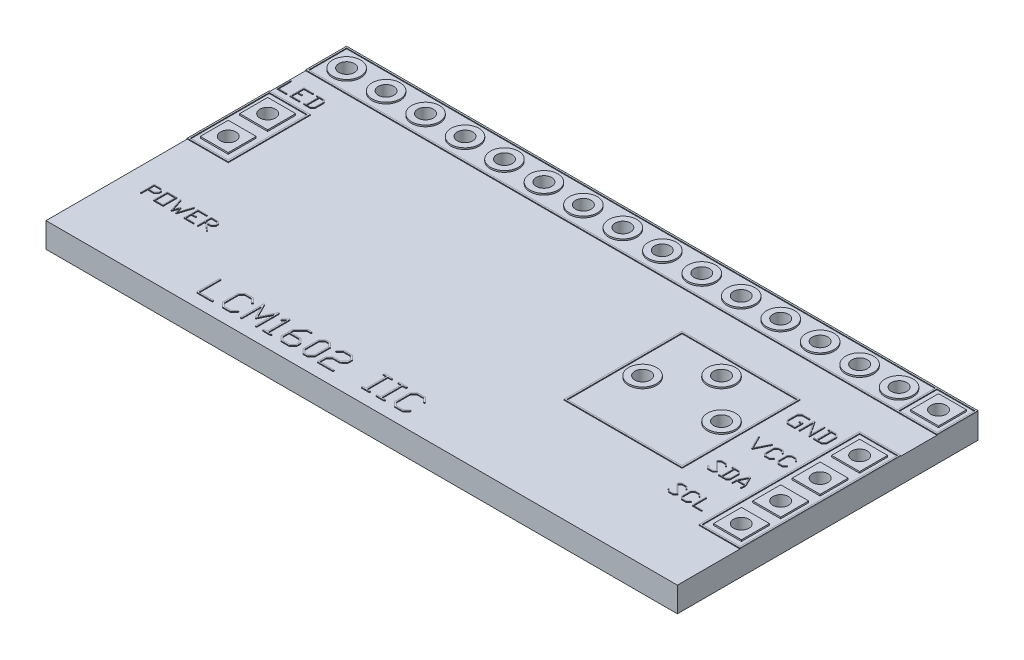
from build123d import *

# Parameters (mm, degrees)
SKETCH3_W                = 40.64
SKETCH3_H                = 19.35
BOSS_EXTRUDE1_DEPTH      = 1.6
SKETCH9_R                = 0.5
CUT_EXTRUDE1_DEPTH       = 44.352546638
SKETCH10_R               = 0.5
CUT_EXTRUDE2_DEPTH       = 44.352546638
SKETCH12_R               = 0.5
CUT_EXTRUDE3_DEPTH       = 44.352546638
SKETCH13_R               = 0.5
CUT_EXTRUDE4_DEPTH       = 44.352546638
BOSS_EXTRUDE2_DEPTH      = 0.1
BOSS_EXTRUDE2_DEPTH_BACK = 1.7
SKETCH14_R               = 0.9
SKETCH14_R_2             = 0.5
SKETCH14_W               = 1.8
SKETCH14_H               = 1.8
BOSS_EXTRUDE3_DEPTH      = 0.05
BOSS_EXTRUDE3_2_DEPTH    = 0.05
BOSS_EXTRUDE3_3_DEPTH    = 0.05
BOSS_EXTRUDE3_4_DEPTH    = 0.05
BOSS_EXTRUDE3_5_DEPTH    = 0.05
BOSS_EXTRUDE3_6_DEPTH    = 0.05
BOSS_EXTRUDE3_7_DEPTH    = 0.05
BOSS_EXTRUDE3_8_DEPTH    = 0.05
BOSS_EXTRUDE3_9_DEPTH    = 0.05
BOSS_EXTRUDE3_10_DEPTH   = 0.05
BOSS_EXTRUDE3_11_DEPTH   = 0.05
BOSS_EXTRUDE3_12_DEPTH   = 0.05
BOSS_EXTRUDE3_13_DEPTH   = 0.05
BOSS_EXTRUDE3_14_DEPTH   = 0.05
BOSS_EXTRUDE3_15_DEPTH   = 0.05
BOSS_EXTRUDE3_16_DEPTH   = 0.05
BOSS_EXTRUDE3_17_DEPTH   = 0.05
BOSS_EXTRUDE3_18_DEPTH   = 0.05
BOSS_EXTRUDE3_19_DEPTH   = 0.05
BOSS_EXTRUDE3_20_DEPTH   = 0.05
BOSS_EXTRUDE3_21_DEPTH   = 0.05
BOSS_EXTRUDE3_22_DEPTH   = 0.05
SKETCH16_W               = 7.6
SKETCH16_H               = 7.6
SKETCH16_W_2             = 7.4
SKETCH16_H_2             = 7.4
BOSS_EXTRUDE4_DEPTH      = 0.05
SKETCH16_W_3             = 2.64
SKETCH16_H_3             = 10.344
SKETCH16_W_4             = 2.44
SKETCH16_H_4             = 10.144
BOSS_EXTRUDE4_2_DEPTH    = 0.05
SKETCH16_H_5             = 5.28
SKETCH16_H_6             = 5.08
BOSS_EXTRUDE4_3_DEPTH    = 0.05
SKETCH16_W_5             = 40.64
SKETCH16_H_7             = 2.64
SKETCH16_W_6             = 37.9
SKETCH16_H_8             = 2.44
BOSS_EXTRUDE4_4_DEPTH    = 0.05
BOSS_EXTRUDE5_DEPTH      = 0.05
BOSS_EXTRUDE5_2_DEPTH    = 0.05
BOSS_EXTRUDE5_3_DEPTH    = 0.05
BOSS_EXTRUDE5_4_DEPTH    = 0.05
SKETCH17_W               = 0.514285715
SKETCH17_H               = 0.792857143
BOSS_EXTRUDE5_5_DEPTH    = 0.05
BOSS_EXTRUDE5_6_DEPTH    = 0.05
BOSS_EXTRUDE5_7_DEPTH    = 0.05
BOSS_EXTRUDE5_8_DEPTH    = 0.05


with BuildPart() as part:
    # Sketch3 → Boss-Extrude1 (new body)
    with BuildSketch(Plane(origin=(0, 0, 0), x_dir=(1, 0, 0), z_dir=(0, 1, 0))):
        with Locations((19.05, -8.405)):
            Rectangle(SKETCH3_W, SKETCH3_H)
    extrude(amount=BOSS_EXTRUDE1_DEPTH)

    # Sketch9 → Cut-Extrude1 (cut, through all)
    with BuildSketch(Plane(origin=(0, 0, 0), x_dir=(1, 0, 0), z_dir=(0, 1, 0))):
        Circle(SKETCH9_R)
        with Locations((2.54, 0)):
            Circle(SKETCH9_R)
        with Locations((5.08, 0)):
            Circle(SKETCH9_R)
        with Locations((7.62, 0)):
            Circle(SKETCH9_R)
        with Locations((10.16, 0)):
            Circle(SKETCH9_R)
        with Locations((12.7, 0)):
            Circle(SKETCH9_R)
        with Locations((15.24, 0)):
            Circle(SKETCH9_R)
        with Locations((17.78, 0)):
            Circle(SKETCH9_R)
        with Locations((20.32, 0)):
            Circle(SKETCH9_R)
        with Locations((22.86, 0)):
            Circle(SKETCH9_R)
        with Locations((25.4, 0)):
            Circle(SKETCH9_R)
        with Locations((27.94, 0)):
            Circle(SKETCH9_R)
        with Locations((30.48, 0)):
            Circle(SKETCH9_R)
        with Locations((33.02, 0)):
            Circle(SKETCH9_R)
        with Locations((35.56, 0)):
            Circle(SKETCH9_R)
        with Locations((38.1, 0)):
            Circle(SKETCH9_R)
    extrude(amount=CUT_EXTRUDE1_DEPTH, mode=Mode.SUBTRACT)

    # Sketch10 → Cut-Extrude2 (cut, through all)
    with BuildSketch(Plane(origin=(0, 0, 0), x_dir=(1, 0, 0), z_dir=(0, 1, 0))):
        with Locations((0, -5.08)):
            Circle(SKETCH10_R)
        with Locations((0, -7.62)):
            Circle(SKETCH10_R)
    extrude(amount=CUT_EXTRUDE2_DEPTH, mode=Mode.SUBTRACT)

    # Sketch12 → Cut-Extrude3 (cut, through all)
    with BuildSketch(Plane(origin=(0, 1.6, 0), x_dir=(1, 0, 0), z_dir=(0, 1, 0))):
        with Locations((38.1, -5.08)):
            Circle(SKETCH12_R)
        with Locations((38.1, -7.62)):
            Circle(SKETCH12_R)
        with Locations((38.1, -10.16)):
            Circle(SKETCH12_R)
        with Locations((38.1, -12.7)):
            Circle(SKETCH12_R)
    extrude(amount=-CUT_EXTRUDE3_DEPTH, mode=Mode.SUBTRACT)

    # Sketch13 → Cut-Extrude4 (cut, through all)
    with BuildSketch(Plane(origin=(0, 0, 0), x_dir=(1, 0, 0), z_dir=(0, 1, 0))):
        with Locations((29.21, -5.08)):
            Circle(SKETCH13_R)
        with Locations((26.67, -7.62)):
            Circle(SKETCH13_R)
        with Locations((31.75, -7.62)):
            Circle(SKETCH13_R)
    extrude(amount=CUT_EXTRUDE4_DEPTH, mode=Mode.SUBTRACT)

    # Sketch14 → Boss-Extrude2 (add, two sides: drawn at the far end of the back side and taken through both)
    # profile 1 of 25: a face of its own
    with BuildSketch(Plane(origin=(0, 1.6, 0), x_dir=(1, 0, 0), z_dir=(0, 1, 0)).offset(-BOSS_EXTRUDE2_DEPTH_BACK)):
        with Locations((35.56, 0)):
            Circle(SKETCH14_R)
        with Locations((35.56, 0)):
            Circle(SKETCH14_R_2, mode=Mode.SUBTRACT)
    # profile 2 of 25: a face of its own
    with BuildSketch(Plane(origin=(0, 1.6, 0), x_dir=(1, 0, 0), z_dir=(0, 1, 0)).offset(-BOSS_EXTRUDE2_DEPTH_BACK)):
        with Locations((33.02, 0)):
            Circle(SKETCH14_R)
        with Locations((33.02, 0)):
            Circle(SKETCH14_R_2, mode=Mode.SUBTRACT)
    # profile 3 of 25: a face of its own
    with BuildSketch(Plane(origin=(0, 1.6, 0), x_dir=(1, 0, 0), z_dir=(0, 1, 0)).offset(-BOSS_EXTRUDE2_DEPTH_BACK)):
        with Locations((30.48, 0)):
            Circle(SKETCH14_R)
        with Locations((30.48, 0)):
            Circle(SKETCH14_R_2, mode=Mode.SUBTRACT)
    # profile 4 of 25: a face of its own
    with BuildSketch(Plane(origin=(0, 1.6, 0), x_dir=(1, 0, 0), z_dir=(0, 1, 0)).offset(-BOSS_EXTRUDE2_DEPTH_BACK)):
        with Locations((27.94, 0)):
            Circle(SKETCH14_R)
        with Locations((27.94, 0)):
            Circle(SKETCH14_R_2, mode=Mode.SUBTRACT)
    # profile 5 of 25: a face of its own
    with BuildSketch(Plane(origin=(0, 1.6, 0), x_dir=(1, 0, 0), z_dir=(0, 1, 0)).offset(-BOSS_EXTRUDE2_DEPTH_BACK)):
        with Locations((25.4, 0)):
            Circle(SKETCH14_R)
        with Locations((25.4, 0)):
            Circle(SKETCH14_R_2, mode=Mode.SUBTRACT)
    # profile 6 of 25: a face of its own
    with BuildSketch(Plane(origin=(0, 1.6, 0), x_dir=(1, 0, 0), z_dir=(0, 1, 0)).offset(-BOSS_EXTRUDE2_DEPTH_BACK)):
        with Locations((22.86, 0)):
            Circle(SKETCH14_R)
        with Locations((22.86, 0)):
            Circle(SKETCH14_R_2, mode=Mode.SUBTRACT)
    # profile 7 of 25: a face of its own
    with BuildSketch(Plane(origin=(0, 1.6, 0), x_dir=(1, 0, 0), z_dir=(0, 1, 0)).offset(-BOSS_EXTRUDE2_DEPTH_BACK)):
        with Locations((20.32, 0)):
            Circle(SKETCH14_R)
        with Locations((20.32, 0)):
            Circle(SKETCH14_R_2, mode=Mode.SUBTRACT)
    # profile 8 of 25: a face of its own
    with BuildSketch(Plane(origin=(0, 1.6, 0), x_dir=(1, 0, 0), z_dir=(0, 1, 0)).offset(-BOSS_EXTRUDE2_DEPTH_BACK)):
        with Locations((17.78, 0)):
            Circle(SKETCH14_R)
        with Locations((17.78, 0)):
            Circle(SKETCH14_R_2, mode=Mode.SUBTRACT)
    # profile 9 of 25: a face of its own
    with BuildSketch(Plane(origin=(0, 1.6, 0), x_dir=(1, 0, 0), z_dir=(0, 1, 0)).offset(-BOSS_EXTRUDE2_DEPTH_BACK)):
        with Locations((15.24, 0)):
            Circle(SKETCH14_R)
        with Locations((15.24, 0)):
            Circle(SKETCH14_R_2, mode=Mode.SUBTRACT)
    # profile 10 of 25: a face of its own
    with BuildSketch(Plane(origin=(0, 1.6, 0), x_dir=(1, 0, 0), z_dir=(0, 1, 0)).offset(-BOSS_EXTRUDE2_DEPTH_BACK)):
        with Locations((12.7, 0)):
            Circle(SKETCH14_R)
        with Locations((12.7, 0)):
            Circle(SKETCH14_R_2, mode=Mode.SUBTRACT)
    # profile 11 of 25: a face of its own
    with BuildSketch(Plane(origin=(0, 1.6, 0), x_dir=(1, 0, 0), z_dir=(0, 1, 0)).offset(-BOSS_EXTRUDE2_DEPTH_BACK)):
        with Locations((10.16, 0)):
            Circle(SKETCH14_R)
        with Locations((10.16, 0)):
            Circle(SKETCH14_R_2, mode=Mode.SUBTRACT)
    # profile 12 of 25: a face of its own
    with BuildSketch(Plane(origin=(0, 1.6, 0), x_dir=(1, 0, 0), z_dir=(0, 1, 0)).offset(-BOSS_EXTRUDE2_DEPTH_BACK)):
        with Locations((7.62, 0)):
            Circle(SKETCH14_R)
        with Locations((7.62, 0)):
            Circle(SKETCH14_R_2, mode=Mode.SUBTRACT)
    # profile 13 of 25: a face of its own
    with BuildSketch(Plane(origin=(0, 1.6, 0), x_dir=(1, 0, 0), z_dir=(0, 1, 0)).offset(-BOSS_EXTRUDE2_DEPTH_BACK)):
        with Locations((5.08, 0)):
            Circle(SKETCH14_R)
        with Locations((5.08, 0)):
            Circle(SKETCH14_R_2, mode=Mode.SUBTRACT)
    # profile 14 of 25: a face of its own
    with BuildSketch(Plane(origin=(0, 1.6, 0), x_dir=(1, 0, 0), z_dir=(0, 1, 0)).offset(-BOSS_EXTRUDE2_DEPTH_BACK)):
        with Locations((2.54, 0)):
            Circle(SKETCH14_R)
        with Locations((2.54, 0)):
            Circle(SKETCH14_R_2, mode=Mode.SUBTRACT)
    # profile 15 of 25: a face of its own
    with BuildSketch(Plane(origin=(0, 1.6, 0), x_dir=(1, 0, 0), z_dir=(0, 1, 0)).offset(-BOSS_EXTRUDE2_DEPTH_BACK)):
        Circle(SKETCH14_R)
        Circle(SKETCH14_R_2, mode=Mode.SUBTRACT)
    # profile 16 of 25: a face of its own
    with BuildSketch(Plane(origin=(0, 1.6, 0), x_dir=(1, 0, 0), z_dir=(0, 1, 0)).offset(-BOSS_EXTRUDE2_DEPTH_BACK)):
        with Locations((29.21, -5.08)):
            Circle(SKETCH14_R)
        with Locations((29.21, -5.08)):
            Circle(SKETCH14_R_2, mode=Mode.SUBTRACT)
    # profile 17 of 25: a face of its own
    with BuildSketch(Plane(origin=(0, 1.6, 0), x_dir=(1, 0, 0), z_dir=(0, 1, 0)).offset(-BOSS_EXTRUDE2_DEPTH_BACK)):
        with Locations((26.67, -7.62)):
            Circle(SKETCH14_R)
        with Locations((26.67, -7.62)):
            Circle(SKETCH14_R_2, mode=Mode.SUBTRACT)
    # profile 18 of 25: a face of its own
    with BuildSketch(Plane(origin=(0, 1.6, 0), x_dir=(1, 0, 0), z_dir=(0, 1, 0)).offset(-BOSS_EXTRUDE2_DEPTH_BACK)):
        with Locations((31.75, -7.62)):
            Circle(SKETCH14_R)
        with Locations((31.75, -7.62)):
            Circle(SKETCH14_R_2, mode=Mode.SUBTRACT)
    # profile 19 of 25: a face of its own
    with BuildSketch(Plane(origin=(0, 1.6, 0), x_dir=(1, 0, 0), z_dir=(0, 1, 0)).offset(-BOSS_EXTRUDE2_DEPTH_BACK)):
        with Locations((38.1, 0)):
            Rectangle(SKETCH14_W, SKETCH14_H)
        with Locations((38.1, 0)):
            Circle(SKETCH14_R_2, mode=Mode.SUBTRACT)
    # profile 20 of 25: a face of its own
    with BuildSketch(Plane(origin=(0, 1.6, 0), x_dir=(1, 0, 0), z_dir=(0, 1, 0)).offset(-BOSS_EXTRUDE2_DEPTH_BACK)):
        with Locations((0, -5.08)):
            Rectangle(SKETCH14_W, SKETCH14_H)
        with Locations((0, -5.08)):
            Circle(SKETCH14_R_2, mode=Mode.SUBTRACT)
    # profile 21 of 25: a face of its own
    with BuildSketch(Plane(origin=(0, 1.6, 0), x_dir=(1, 0, 0), z_dir=(0, 1, 0)).offset(-BOSS_EXTRUDE2_DEPTH_BACK)):
        with Locations((38.1, -5.08)):
            Rectangle(SKETCH14_W, SKETCH14_H)
        with Locations((38.1, -5.08)):
            Circle(SKETCH14_R_2, mode=Mode.SUBTRACT)
    # profile 22 of 25: a face of its own
    with BuildSketch(Plane(origin=(0, 1.6, 0), x_dir=(1, 0, 0), z_dir=(0, 1, 0)).offset(-BOSS_EXTRUDE2_DEPTH_BACK)):
        with Locations((0, -7.62)):
            Rectangle(SKETCH14_W, SKETCH14_H)
        with Locations((0, -7.62)):
            Circle(SKETCH14_R_2, mode=Mode.SUBTRACT)
    # profile 23 of 25: a face of its own
    with BuildSketch(Plane(origin=(0, 1.6, 0), x_dir=(1, 0, 0), z_dir=(0, 1, 0)).offset(-BOSS_EXTRUDE2_DEPTH_BACK)):
        with Locations((38.1, -7.62)):
            Rectangle(SKETCH14_W, SKETCH14_H)
        with Locations((38.1, -7.62)):
            Circle(SKETCH14_R_2, mode=Mode.SUBTRACT)
    # profile 24 of 25: a face of its own
    with BuildSketch(Plane(origin=(0, 1.6, 0), x_dir=(1, 0, 0), z_dir=(0, 1, 0)).offset(-BOSS_EXTRUDE2_DEPTH_BACK)):
        with Locations((38.1, -10.16)):
            Rectangle(SKETCH14_W, SKETCH14_H)
        with Locations((38.1, -10.16)):
            Circle(SKETCH14_R_2, mode=Mode.SUBTRACT)
    # profile 25 of 25: a face of its own
    with BuildSketch(Plane(origin=(0, 1.6, 0), x_dir=(1, 0, 0), z_dir=(0, 1, 0)).offset(-BOSS_EXTRUDE2_DEPTH_BACK)):
        with Locations((38.1, -12.684)):
            Rectangle(SKETCH14_W, SKETCH14_H)
        with Locations((38.1, -12.7)):
            Circle(SKETCH14_R_2, mode=Mode.SUBTRACT)
    extrude(amount=BOSS_EXTRUDE2_DEPTH + BOSS_EXTRUDE2_DEPTH_BACK)


with BuildPart() as body_2:
    # Sketch15 → Boss-Extrude3 (new body)
    with BuildSketch(Plane(origin=(0, 1.6, 0), x_dir=(1, 0, 0), z_dir=(0, 1, 0))):
        with BuildLine():
            add(Edge.make_bspline(
                [(7.677477679, -15.777596108), (7.679693563, -15.779901875), (7.684652044, -15.785061485), (7.688697088, -15.796562613), (7.691066716, -15.810963145), (7.691300304, -15.821664175), (7.691428571, -15.827540305)],
                knots=[0, 0, 0, 0, 0.713001458, 1.595481997, 2.679635581, 4, 4, 4, 4], degree=3))
            Line((7.691428571, -15.827540305), (7.691428571, -17.17714968))
            Line((7.691428571, -17.17714968), (8.595167411, -17.17714968))
            add(Edge.make_bspline(
                [(8.595167411, -17.17714968), (8.598309442, -17.177690636), (8.604482542, -17.178753445), (8.61252613, -17.183906779), (8.619319847, -17.191094696), (8.621956075, -17.19730673), (8.623348214, -17.20058718)],
                knots=[0, 0, 0, 0, 0.979286762, 1.923989319, 2.903700658, 4, 4, 4, 4], degree=3))
            add(Edge.make_bspline(
                [(8.623348214, -17.20058718), (8.625209427, -17.204042148), (8.628784231, -17.210678056), (8.629259017, -17.218191126), (8.629486607, -17.221792537)],
                knots=[0, 0, 0, 0, 1.041294532, 2, 2, 2, 2], degree=3))
            add(Edge.make_bspline(
                [(8.629486607, -17.221792537), (8.628999811, -17.22677293), (8.627972581, -17.237282477), (8.622279691, -17.249815705), (8.61457157, -17.25860061), (8.605997139, -17.263448111), (8.595048099, -17.266131882), (8.586999399, -17.26632831), (8.582611607, -17.266435394)],
                knots=[0, 0, 0, 0, 1.2170084, 2.568112234, 3.275262371, 4.038509158, 4.930682846, 6, 6, 6, 6], degree=3))
            Line((8.582611607, -17.266435394), (7.628649554, -17.266435394))
            add(Edge.make_bspline(
                [(7.628649554, -17.266435394), (7.625512438, -17.26497023), (7.61948465, -17.262155002), (7.611737169, -17.256134847), (7.605566472, -17.248782854), (7.603290735, -17.242897339), (7.602142857, -17.239928698)],
                knots=[0, 0, 0, 0, 1.070067353, 2.056073078, 3.019487386, 4, 4, 4, 4], degree=3))
            Line((7.602142857, -17.239928698), (7.602142857, -17.199192091))
            Line((7.602142857, -17.199192091), (7.602142857, -15.794895216))
            add(Edge.make_bspline(
                [(7.602142857, -15.794895216), (7.603669446, -15.791115685), (7.606664325, -15.783700961), (7.615262881, -15.775274799), (7.625834413, -15.768901867), (7.63404183, -15.767292794), (7.638415179, -15.766435394)],
                knots=[0, 0, 0, 0, 0.995433738, 1.952852496, 2.909170772, 4, 4, 4, 4], degree=3))
            add(Edge.make_bspline(
                [(7.638415179, -15.766435394), (7.646160497, -15.766672356), (7.66018721, -15.767101492), (7.672129654, -15.774350073), (7.677477679, -15.777596108)],
                knots=[0, 0, 0, 0, 1.104366723, 2, 2, 2, 2], degree=3))
        make_face()
    extrude(amount=BOSS_EXTRUDE3_DEPTH)


with BuildPart() as body_3:
    # Sketch15 → Boss-Extrude3 2 (new body)
    with BuildSketch(Plane(origin=(0, 1.6, 0), x_dir=(1, 0, 0), z_dir=(0, 1, 0))):
        with BuildLine():
            Line((9.789921875, -15.778991198), (10.036015625, -16.035129591))
            add(Edge.make_bspline(
                [(10.036015625, -16.035129591), (10.037201771, -16.038068894), (10.039622788, -16.044068242), (10.040005623, -16.050528599), (10.040200893, -16.053823787)],
                knots=[0, 0, 0, 0, 0.979874501, 2, 2, 2, 2], degree=3))
            add(Edge.make_bspline(
                [(10.040200893, -16.053823787), (10.040178373, -16.056825306), (10.040141373, -16.061756743), (10.038780389, -16.066483068), (10.038247768, -16.068332716)],
                knots=[0, 0, 0, 0, 1.217299785, 2, 2, 2, 2], degree=3))
            add(Edge.make_bspline(
                [(10.038247768, -16.068332716), (10.036421326, -16.072203972), (10.032840867, -16.079792975), (10.02372819, -16.088510193), (10.012721814, -16.095157526), (10.004210648, -16.096778679), (9.999743304, -16.097629591)],
                knots=[0, 0, 0, 0, 1.003821697, 1.967838075, 2.93335799, 4, 4, 4, 4], degree=3))
            add(Edge.make_bspline(
                [(9.999743304, -16.097629591), (9.992889849, -16.096094566), (9.980076651, -16.093224689), (9.969885331, -16.084995256), (9.965145089, -16.081167537)],
                knots=[0, 0, 0, 0, 1.069749206, 2, 2, 2, 2], degree=3))
            Line((9.965145089, -16.081167537), (9.746395089, -15.855721108))
            Line((9.746395089, -15.855721108), (9.310848214, -15.855721108))
            Line((9.310848214, -15.855721108), (9.102142857, -16.066100573))
            Line((9.102142857, -16.066100573), (9.102142857, -16.968723341))
            Line((9.102142857, -16.968723341), (9.310848214, -17.17714968))
            Line((9.310848214, -17.17714968), (9.746395089, -17.17714968))
            Line((9.746395089, -17.17714968), (9.977421875, -16.957841644))
            add(Edge.make_bspline(
                [(9.977421875, -16.957841644), (9.98041595, -16.956099872), (9.986701027, -16.952443593), (9.99397918, -16.952140812), (9.997790179, -16.951982269)],
                knots=[0, 0, 0, 0, 0.952756744, 2, 2, 2, 2], degree=3))
            add(Edge.make_bspline(
                [(9.997790179, -16.951982269), (10.00254839, -16.952689529), (10.012902426, -16.954228553), (10.024243666, -16.961975083), (10.032387205, -16.970123016), (10.036827525, -16.977834802), (10.039867562, -16.986451583), (10.040086991, -16.992597727), (10.040200893, -16.995788073)],
                knots=[0, 0, 0, 0, 1.277917555, 2.780794186, 3.575257868, 4.358664856, 5.148014333, 6, 6, 6, 6], degree=3))
            Line((10.040200893, -16.995788073), (10.036015625, -17.015598341))
            Line((10.036015625, -17.015598341), (9.785457589, -17.262529144))
            Line((9.785457589, -17.262529144), (9.768995536, -17.266435394))
            Line((9.768995536, -17.266435394), (9.273738839, -17.266435394))
            Line((9.273738839, -17.266435394), (9.261462054, -17.258343876))
            Line((9.261462054, -17.258343876), (9.012857143, -17.008064858))
            Line((9.012857143, -17.008064858), (9.012857143, -16.987696555))
            Line((9.012857143, -16.987696555), (9.022901786, -16.016714412))
            Line((9.022901786, -16.016714412), (9.271227679, -15.770620662))
            Line((9.271227679, -15.770620662), (9.283504464, -15.766435394))
            Line((9.283504464, -15.766435394), (9.775691964, -15.768388519))
            Line((9.775691964, -15.768388519), (9.789921875, -15.778991198))
        make_face()
    extrude(amount=BOSS_EXTRUDE3_2_DEPTH)


with BuildPart() as body_4:
    # Sketch15 → Boss-Extrude3 3 (new body)
    with BuildSketch(Plane(origin=(0, 1.6, 0), x_dir=(1, 0, 0), z_dir=(0, 1, 0))):
        with BuildLine():
            Line((10.495279018, -15.77871218), (10.507555804, -15.795174233))
            Line((10.507555804, -15.795174233), (10.9403125, -16.663198787))
            Line((10.9403125, -16.663198787), (11.381439732, -15.782897448))
            add(Edge.make_bspline(
                [(11.381439732, -15.782897448), (11.385897373, -15.779098708), (11.394934837, -15.771397108), (11.406347977, -15.768104138), (11.412131696, -15.766435394)],
                knots=[0, 0, 0, 0, 0.986480618, 2, 2, 2, 2], degree=3))
            add(Edge.make_bspline(
                [(11.412131696, -15.766435394), (11.418103428, -15.767107078), (11.431217107, -15.768582067), (11.442705349, -15.775140396), (11.448962054, -15.77871218)],
                knots=[0, 0, 0, 0, 0.910763831, 2, 2, 2, 2], degree=3))
            add(Edge.make_bspline(
                [(11.448962054, -15.77871218), (11.450584136, -15.781824393), (11.454467877, -15.789275941), (11.457264839, -15.803994049), (11.459138171, -15.823201634), (11.459233137, -15.837667548), (11.459285714, -15.845676466)],
                knots=[0, 0, 0, 0, 0.61262826, 1.466811119, 2.597523678, 4, 4, 4, 4], degree=3))
            Line((11.459285714, -15.845676466), (11.459285714, -17.233790305))
            add(Edge.make_bspline(
                [(11.459285714, -17.233790305), (11.457865953, -17.238692109), (11.455170064, -17.247999815), (11.445419857, -17.259472739), (11.431028451, -17.26560933), (11.420372176, -17.266146556), (11.414642857, -17.266435394)],
                knots=[0, 0, 0, 0, 1.00070164, 1.90016491, 2.87102907, 4, 4, 4, 4], degree=3))
            add(Edge.make_bspline(
                [(11.414642857, -17.266435394), (11.408709283, -17.265993019), (11.397312777, -17.265143357), (11.384165044, -17.258656618), (11.376546943, -17.2503678), (11.372611389, -17.242231543), (11.370472524, -17.232504386), (11.370164599, -17.225523891), (11.37, -17.221792537)],
                knots=[0, 0, 0, 0, 1.478218517, 2.839186875, 3.529803866, 4.256954127, 5.068271997, 6, 6, 6, 6], degree=3))
            Line((11.37, -17.221792537), (11.37, -16.001926466))
            Line((11.37, -16.001926466), (11.363861607, -16.006111733))
            Line((11.363861607, -16.006111733), (10.977142857, -16.785129591))
            add(Edge.make_bspline(
                [(10.977142857, -16.785129591), (10.975047934, -16.787962377), (10.971083059, -16.79332374), (10.963077109, -16.799069886), (10.954247388, -16.80305153), (10.947797991, -16.803377809), (10.944497768, -16.803544769)],
                knots=[0, 0, 0, 0, 1.074848392, 2.034269473, 2.994115359, 4, 4, 4, 4], degree=3))
            add(Edge.make_bspline(
                [(10.944497768, -16.803544769), (10.93997017, -16.803270088), (10.931251577, -16.802741148), (10.9193267, -16.797263831), (10.908954588, -16.788869834), (10.904280415, -16.78113132), (10.901808036, -16.777038073)],
                knots=[0, 0, 0, 0, 1.020306232, 1.964758033, 2.923469163, 4, 4, 4, 4], degree=3))
            Line((10.901808036, -16.777038073), (10.512857143, -16.001926466))
            Line((10.512857143, -16.001926466), (10.512857143, -17.234069323))
            add(Edge.make_bspline(
                [(10.512857143, -17.234069323), (10.512281422, -17.236744707), (10.511091546, -17.242274077), (10.505778542, -17.249602929), (10.498836031, -17.256792687), (10.492697145, -17.26035059), (10.489419643, -17.262250126)],
                knots=[0, 0, 0, 0, 0.856249677, 1.769660496, 2.809239503, 4, 4, 4, 4], degree=3))
            add(Edge.make_bspline(
                [(10.489419643, -17.262250126), (10.486664326, -17.263429757), (10.479927458, -17.266314004), (10.472565356, -17.266390302), (10.468214286, -17.266435394)],
                knots=[0, 0, 0, 0, 0.81798157, 2, 2, 2, 2], degree=3))
            add(Edge.make_bspline(
                [(10.468214286, -17.266435394), (10.461923058, -17.26611299), (10.450336186, -17.265519201), (10.436981222, -17.259577147), (10.429682414, -17.251582117), (10.4261677, -17.24338141), (10.424020591, -17.233249964), (10.423728723, -17.22580487), (10.423571429, -17.221792537)],
                knots=[0, 0, 0, 0, 1.545046916, 2.845590851, 3.461706343, 4.16857593, 5.013003299, 6, 6, 6, 6], degree=3))
            Line((10.423571429, -17.221792537), (10.423571429, -15.796848341))
            add(Edge.make_bspline(
                [(10.423571429, -15.796848341), (10.42516741, -15.792780697), (10.428291942, -15.784817271), (10.43775289, -15.77543925), (10.450057328, -15.768864017), (10.459572265, -15.767273609), (10.464587054, -15.766435394)],
                knots=[0, 0, 0, 0, 0.958269548, 1.876051081, 2.880585875, 4, 4, 4, 4], degree=3))
            add(Edge.make_bspline(
                [(10.464587054, -15.766435394), (10.470488713, -15.766895968), (10.482015188, -15.767795511), (10.490929107, -15.775132027), (10.495279018, -15.77871218)],
                knots=[0, 0, 0, 0, 1.024018212, 2, 2, 2, 2], degree=3))
        make_face()
    extrude(amount=BOSS_EXTRUDE3_3_DEPTH)


with BuildPart() as body_5:
    # Sketch15 → Boss-Extrude3 4 (new body)
    with BuildSketch(Plane(origin=(0, 1.6, 0), x_dir=(1, 0, 0), z_dir=(0, 1, 0))):
        with BuildLine():
            Line((12.151529018, -15.790709948), (12.155714286, -15.813031376))
            Line((12.155714286, -15.813031376), (12.155714286, -17.17714968))
            Line((12.155714286, -17.17714968), (12.361071429, -17.17714968))
            add(Edge.make_bspline(
                [(12.361071429, -17.17714968), (12.364839988, -17.178787932), (12.372196206, -17.181985795), (12.380791642, -17.190571168), (12.38704649, -17.201431972), (12.388667604, -17.209800652), (12.38953125, -17.214259055)],
                knots=[0, 0, 0, 0, 0.992698585, 1.937744927, 2.901336532, 4, 4, 4, 4], degree=3))
            add(Edge.make_bspline(
                [(12.38953125, -17.214259055), (12.389189934, -17.221465608), (12.388562038, -17.234723044), (12.382837989, -17.250256108), (12.374637759, -17.259220689), (12.365873931, -17.263306364), (12.355119181, -17.266186047), (12.34705337, -17.266347421), (12.34265625, -17.266435394)],
                knots=[0, 0, 0, 0, 1.591431224, 2.927654684, 3.552880068, 4.224068307, 5.031841402, 6, 6, 6, 6], degree=3))
            Line((12.34265625, -17.266435394), (11.862745536, -17.266435394))
            add(Edge.make_bspline(
                [(11.862745536, -17.266435394), (11.858966005, -17.264908805), (11.851551282, -17.261913926), (11.843125119, -17.25331537), (11.836752187, -17.242743838), (11.835143114, -17.234536421), (11.834285714, -17.230163073)],
                knots=[0, 0, 0, 0, 0.995433738, 1.952852496, 2.909170772, 4, 4, 4, 4], degree=3))
            add(Edge.make_bspline(
                [(11.834285714, -17.230163073), (11.834680002, -17.222551489), (11.835394055, -17.208766968), (11.842758869, -17.192751572), (11.852976554, -17.184107749), (11.864152878, -17.179776855), (11.87846478, -17.177556869), (11.889057715, -17.177293344), (11.894832589, -17.17714968)],
                knots=[0, 0, 0, 0, 1.453281503, 2.631882098, 3.238351681, 3.972534961, 4.894701619, 6, 6, 6, 6], degree=3))
            Line((11.894832589, -17.17714968), (12.066428571, -17.17714968))
            Line((12.066428571, -17.17714968), (12.066428571, -15.922685394))
            Line((12.066428571, -15.922685394), (11.896227679, -16.091491198))
            add(Edge.make_bspline(
                [(11.896227679, -16.091491198), (11.892631745, -16.092668956), (11.886173995, -16.094784031), (11.879413425, -16.09540242), (11.876417411, -16.095676466)],
                knots=[0, 0, 0, 0, 1.113680041, 2, 2, 2, 2], degree=3))
            add(Edge.make_bspline(
                [(11.876417411, -16.095676466), (11.870806773, -16.095191187), (11.859759767, -16.094235703), (11.845234291, -16.084975759), (11.835475275, -16.069299786), (11.834706555, -16.056774553), (11.834285714, -16.049917537)],
                knots=[0, 0, 0, 0, 0.954151961, 1.878667556, 2.838663487, 4, 4, 4, 4], degree=3))
            Line((11.834285714, -16.049917537), (11.838470982, -16.030944323))
            Line((11.838470982, -16.030944323), (12.090703125, -15.772573787))
            add(Edge.make_bspline(
                [(12.090703125, -15.772573787), (12.093879407, -15.770719657), (12.100751699, -15.766708012), (12.108732417, -15.766530736), (12.113024554, -15.766435394)],
                knots=[0, 0, 0, 0, 0.924373516, 2, 2, 2, 2], degree=3))
            add(Edge.make_bspline(
                [(12.113024554, -15.766435394), (12.115183068, -15.766841942), (12.121496807, -15.768031109), (12.131674456, -15.772738607), (12.144036269, -15.778953867), (12.149096271, -15.786892982), (12.151529018, -15.790709948)],
                knots=[0, 0, 0, 0, 0.55950191, 1.636565057, 2.863708407, 4, 4, 4, 4], degree=3))
        make_face()
    extrude(amount=BOSS_EXTRUDE3_4_DEPTH)


with BuildPart() as body_6:
    # Sketch15 → Boss-Extrude3 5 (new body)
    with BuildSketch(Plane(origin=(0, 1.6, 0), x_dir=(1, 0, 0), z_dir=(0, 1, 0))):
        with BuildLine():
            add(Edge.make_bspline(
                [(13.543549107, -15.768667537), (13.548871316, -15.771947797), (13.558252731, -15.777729884), (13.567269004, -15.79007309), (13.571334824, -15.801972549), (13.571791832, -15.809659013), (13.572008929, -15.813310394)],
                knots=[0, 0, 0, 0, 1.332593971, 2.348952958, 3.215685826, 4, 4, 4, 4], degree=3))
            add(Edge.make_bspline(
                [(13.572008929, -15.813310394), (13.571765168, -15.818795238), (13.571316147, -15.828898612), (13.56466461, -15.842190532), (13.553912977, -15.852017498), (13.544579596, -15.854439847), (13.539642857, -15.855721108)],
                knots=[0, 0, 0, 0, 1.11349976, 2.051125815, 2.969175056, 4, 4, 4, 4], degree=3))
            Line((13.539642857, -15.855721108), (13.313080357, -15.855721108))
            Line((13.313080357, -15.855721108), (12.87, -16.303823787))
            Line((12.87, -16.303823787), (12.87, -16.480721108))
            Line((12.87, -16.480721108), (13.563080357, -16.488812626))
            Line((13.563080357, -16.488812626), (13.810290179, -16.738533608))
            Line((13.810290179, -16.738533608), (13.816428571, -16.752763519))
            Line((13.816428571, -16.752763519), (13.816428571, -17.002484501))
            Line((13.816428571, -17.002484501), (13.810290179, -17.018667537))
            Line((13.810290179, -17.018667537), (13.5575, -17.264482269))
            Line((13.5575, -17.264482269), (13.536852679, -17.266435394))
            Line((13.536852679, -17.266435394), (13.04578125, -17.266435394))
            Line((13.04578125, -17.266435394), (13.033504464, -17.258343876))
            Line((13.033504464, -17.258343876), (12.782667411, -17.008064858))
            Line((12.782667411, -17.008064858), (12.780714286, -16.987696555))
            Line((12.780714286, -16.987696555), (12.786852679, -16.256948787))
            Line((12.786852679, -16.256948787), (13.287131696, -15.766435394))
            Line((13.287131696, -15.766435394), (13.543549107, -15.768667537))
        make_face()
        Polygon((13.727142857, -16.777038073), (13.515368304, -16.570006823), (12.87, -16.570006823), (12.87, -16.972071555), (13.079821429, -17.17714968), (13.517321429, -17.17714968), (13.727142857, -16.97011843), align=None, mode=Mode.SUBTRACT)
    extrude(amount=BOSS_EXTRUDE3_5_DEPTH)


with BuildPart() as body_7:
    # Sketch15 → Boss-Extrude3 6 (new body)
    with BuildSketch(Plane(origin=(0, 1.6, 0), x_dir=(1, 0, 0), z_dir=(0, 1, 0))):
        Polygon((14.738861607, -15.774526912), (14.990814732, -16.02480593), (14.995, -16.037082716), (14.988861607, -17.013924233), (14.732723214, -17.264482269), (14.718214286, -17.266435394), (14.457890625, -17.266435394), (14.445613839, -17.258343876), (14.193381696, -17.008064858), (14.191428571, -16.987696555), (14.199799107, -16.016714412), (14.453705357, -15.770620662), (14.466261161, -15.766435394), (14.722399554, -15.768388519), align=None)
        Polygon((14.905714286, -16.064426466), (14.694776786, -15.855721108), (14.491651786, -15.855721108), (14.280714286, -16.064426466), (14.280714286, -16.968444323), (14.491651786, -17.17714968), (14.694776786, -17.17714968), (14.905714286, -16.966491198), align=None, mode=Mode.SUBTRACT)
    extrude(amount=BOSS_EXTRUDE3_6_DEPTH)


with BuildPart() as body_8:
    # Sketch15 → Boss-Extrude3 7 (new body)
    with BuildSketch(Plane(origin=(0, 1.6, 0), x_dir=(1, 0, 0), z_dir=(0, 1, 0))):
        with BuildLine():
            Line((16.153482143, -15.77871218), (16.401529018, -16.030107269))
            Line((16.401529018, -16.030107269), (16.405714286, -16.048801466))
            Line((16.405714286, -16.048801466), (16.405714286, -16.297964412))
            Line((16.405714286, -16.297964412), (16.401529018, -16.312473341))
            Line((16.401529018, -16.312473341), (16.147622768, -16.56386843))
            Line((16.147622768, -16.56386843), (16.129207589, -16.570006823))
            Line((16.129207589, -16.570006823), (15.672455357, -16.570006823))
            Line((15.672455357, -16.570006823), (15.459285714, -16.775084948))
            Line((15.459285714, -16.775084948), (15.459285714, -17.17714968))
            Line((15.459285714, -17.17714968), (16.373069196, -17.17714968))
            add(Edge.make_bspline(
                [(16.373069196, -17.17714968), (16.377972241, -17.178249414), (16.387303094, -17.180342287), (16.398908901, -17.18998792), (16.404924631, -17.204777825), (16.405435677, -17.215789345), (16.405714286, -17.221792537)],
                knots=[0, 0, 0, 0, 0.972653314, 1.851030225, 2.828438158, 4, 4, 4, 4], degree=3))
            add(Edge.make_bspline(
                [(16.405714286, -17.221792537), (16.405420257, -17.227707547), (16.404862482, -17.238928389), (16.399438222, -17.251985002), (16.392106099, -17.260119457), (16.38365278, -17.263975887), (16.372890496, -17.265979261), (16.364895358, -17.266273906), (16.360513393, -17.266435394)],
                knots=[0, 0, 0, 0, 1.434830483, 2.721889557, 3.346325591, 4.054937858, 4.933952885, 6, 6, 6, 6], degree=3))
            Line((16.360513393, -17.266435394), (15.396785714, -17.266435394))
            add(Edge.make_bspline(
                [(15.396785714, -17.266435394), (15.393548396, -17.26498469), (15.38739805, -17.262228602), (15.379591194, -17.256131679), (15.373499814, -17.248840641), (15.371162909, -17.24307624), (15.37, -17.240207716)],
                knots=[0, 0, 0, 0, 1.095907464, 2.08203456, 3.045567458, 4, 4, 4, 4], degree=3))
            Line((15.37, -17.240207716), (15.37, -17.199750126))
            Line((15.37, -17.199750126), (15.37, -16.731279144))
            Line((15.37, -16.731279144), (15.624464286, -16.484627358))
            Line((15.624464286, -16.484627358), (15.637020089, -16.480721108))
            Line((15.637020089, -16.480721108), (16.102979911, -16.480721108))
            Line((16.102979911, -16.480721108), (16.316428571, -16.268388519))
            Line((16.316428571, -16.268388519), (16.316428571, -16.068053698))
            Line((16.316428571, -16.068053698), (16.105770089, -15.855721108))
            Line((16.105770089, -15.855721108), (15.666316964, -15.855721108))
            Line((15.666316964, -15.855721108), (15.433337054, -16.091491198))
            add(Edge.make_bspline(
                [(15.433337054, -16.091491198), (15.429647369, -16.09266937), (15.423001171, -16.094791602), (15.416057564, -16.095404031), (15.41296875, -16.095676466)],
                knots=[0, 0, 0, 0, 1.110314269, 2, 2, 2, 2], degree=3))
            add(Edge.make_bspline(
                [(15.41296875, -16.095676466), (15.407269577, -16.095198156), (15.396058371, -16.094257244), (15.383775265, -16.086529747), (15.376635139, -16.077887893), (15.372585144, -16.069815497), (15.370522313, -16.06024882), (15.3701791, -16.053460113), (15.37, -16.049917537)],
                knots=[0, 0, 0, 0, 1.43776488, 2.828318719, 3.533469534, 4.273415568, 5.099010321, 6, 6, 6, 6], degree=3))
            Line((15.37, -16.049917537), (15.374185268, -16.030944323))
            Line((15.374185268, -16.030944323), (15.626417411, -15.77480593))
            Line((15.626417411, -15.77480593), (15.642879464, -15.766435394))
            Line((15.642879464, -15.766435394), (16.138973214, -15.768388519))
            Line((16.138973214, -15.768388519), (16.153482143, -15.77871218))
        make_face()
    extrude(amount=BOSS_EXTRUDE3_7_DEPTH)


with BuildPart() as body_9:
    # Sketch15 → Boss-Extrude3 8 (new body)
    with BuildSketch(Plane(origin=(0, 1.6, 0), x_dir=(1, 0, 0), z_dir=(0, 1, 0))):
        with BuildLine():
            add(Edge.make_bspline(
                [(18.718214286, -15.768667537), (18.721975256, -15.769591365), (18.729308885, -15.771392764), (18.738136769, -15.779076194), (18.744262618, -15.789766119), (18.745825694, -15.798154588), (18.746674107, -15.802707716)],
                knots=[0, 0, 0, 0, 0.959857568, 1.871654996, 2.844768166, 4, 4, 4, 4], degree=3))
            add(Edge.make_bspline(
                [(18.746674107, -15.802707716), (18.746498074, -15.809881886), (18.746172477, -15.82315152), (18.740971624, -15.835336115), (18.738582589, -15.840933162)],
                knots=[0, 0, 0, 0, 1.081291397, 2, 2, 2, 2], degree=3))
            add(Edge.make_bspline(
                [(18.738582589, -15.840933162), (18.73579768, -15.843233308), (18.729743789, -15.848233409), (18.717509948, -15.852697743), (18.702532945, -15.855424809), (18.691538538, -15.855616844), (18.685569196, -15.855721108)],
                knots=[0, 0, 0, 0, 0.764684754, 1.662286672, 2.730753782, 4, 4, 4, 4], degree=3))
            Line((18.685569196, -15.855721108), (18.512857143, -15.855721108))
            Line((18.512857143, -15.855721108), (18.512857143, -17.17714968))
            Line((18.512857143, -17.17714968), (18.718214286, -17.17714968))
            add(Edge.make_bspline(
                [(18.718214286, -17.17714968), (18.721982845, -17.178787932), (18.729339064, -17.181985795), (18.737934499, -17.190571168), (18.744189347, -17.201431972), (18.745810461, -17.209800652), (18.746674107, -17.214259055)],
                knots=[0, 0, 0, 0, 0.992698585, 1.937744927, 2.901336532, 4, 4, 4, 4], degree=3))
            add(Edge.make_bspline(
                [(18.746674107, -17.214259055), (18.746332791, -17.221465608), (18.745704895, -17.234723044), (18.739980846, -17.250256108), (18.731780616, -17.259220689), (18.723016788, -17.263306364), (18.712262038, -17.266186047), (18.704196227, -17.266347421), (18.699799107, -17.266435394)],
                knots=[0, 0, 0, 0, 1.591431224, 2.927654684, 3.552880068, 4.224068307, 5.031841402, 6, 6, 6, 6], degree=3))
            Line((18.699799107, -17.266435394), (18.219888393, -17.266435394))
            add(Edge.make_bspline(
                [(18.219888393, -17.266435394), (18.216108862, -17.264908805), (18.208694139, -17.261913926), (18.200267976, -17.25331537), (18.193895044, -17.242743838), (18.192285971, -17.234536421), (18.191428571, -17.230163073)],
                knots=[0, 0, 0, 0, 0.995433738, 1.952852496, 2.909170772, 4, 4, 4, 4], degree=3))
            add(Edge.make_bspline(
                [(18.191428571, -17.230163073), (18.19182286, -17.222551489), (18.192536913, -17.208766968), (18.199901726, -17.192751572), (18.210119411, -17.184107749), (18.221295735, -17.179776855), (18.235607637, -17.177556869), (18.246200573, -17.177293344), (18.251975446, -17.17714968)],
                knots=[0, 0, 0, 0, 1.453281503, 2.631882098, 3.238351681, 3.972534961, 4.894701619, 6, 6, 6, 6], degree=3))
            Line((18.251975446, -17.17714968), (18.423571429, -17.17714968))
            Line((18.423571429, -17.17714968), (18.423571429, -15.855721108))
            Line((18.423571429, -15.855721108), (18.2215625, -15.855721108))
            add(Edge.make_bspline(
                [(18.2215625, -15.855721108), (18.217511487, -15.85441349), (18.209658856, -15.851878755), (18.200328146, -15.843452763), (18.193785079, -15.83215653), (18.192254277, -15.823357747), (18.191428571, -15.818611733)],
                knots=[0, 0, 0, 0, 0.9895212, 1.918123684, 2.877047584, 4, 4, 4, 4], degree=3))
            add(Edge.make_bspline(
                [(18.191428571, -15.818611733), (18.191494474, -15.814601656), (18.191618026, -15.807083629), (18.193542296, -15.796834202), (18.196533191, -15.788269301), (18.202611711, -15.779714686), (18.212568114, -15.772026632), (18.22156169, -15.768290363), (18.226026786, -15.766435394)],
                knots=[0, 0, 0, 0, 1.057386001, 1.98236945, 2.744243853, 3.432469218, 4.725282279, 6, 6, 6, 6], degree=3))
            Line((18.226026786, -15.766435394), (18.718214286, -15.768667537))
        make_face()
    extrude(amount=BOSS_EXTRUDE3_8_DEPTH)


with BuildPart() as body_10:
    # Sketch15 → Boss-Extrude3 9 (new body)
    with BuildSketch(Plane(origin=(0, 1.6, 0), x_dir=(1, 0, 0), z_dir=(0, 1, 0))):
        with BuildLine():
            add(Edge.make_bspline(
                [(19.664642857, -15.768667537), (19.668403828, -15.769591365), (19.675737456, -15.771392764), (19.68456534, -15.779076194), (19.69069119, -15.789766119), (19.692254266, -15.798154588), (19.693102679, -15.802707716)],
                knots=[0, 0, 0, 0, 0.959857568, 1.871654996, 2.844768166, 4, 4, 4, 4], degree=3))
            add(Edge.make_bspline(
                [(19.693102679, -15.802707716), (19.692926646, -15.809881886), (19.692601048, -15.82315152), (19.687400195, -15.835336115), (19.685011161, -15.840933162)],
                knots=[0, 0, 0, 0, 1.081291397, 2, 2, 2, 2], degree=3))
            add(Edge.make_bspline(
                [(19.685011161, -15.840933162), (19.682226251, -15.843233308), (19.67617236, -15.848233409), (19.66393852, -15.852697743), (19.648961516, -15.855424809), (19.637967109, -15.855616844), (19.631997768, -15.855721108)],
                knots=[0, 0, 0, 0, 0.764684754, 1.662286672, 2.730753782, 4, 4, 4, 4], degree=3))
            Line((19.631997768, -15.855721108), (19.459285714, -15.855721108))
            Line((19.459285714, -15.855721108), (19.459285714, -17.17714968))
            Line((19.459285714, -17.17714968), (19.664642857, -17.17714968))
            add(Edge.make_bspline(
                [(19.664642857, -17.17714968), (19.668411417, -17.178787932), (19.675767635, -17.181985795), (19.68436307, -17.190571168), (19.690617918, -17.201431972), (19.692239032, -17.209800652), (19.693102679, -17.214259055)],
                knots=[0, 0, 0, 0, 0.992698585, 1.937744927, 2.901336532, 4, 4, 4, 4], degree=3))
            add(Edge.make_bspline(
                [(19.693102679, -17.214259055), (19.692761363, -17.221465608), (19.692133466, -17.234723044), (19.686409417, -17.250256108), (19.678209188, -17.259220689), (19.669445359, -17.263306364), (19.65869061, -17.266186047), (19.650624798, -17.266347421), (19.646227679, -17.266435394)],
                knots=[0, 0, 0, 0, 1.591431224, 2.927654684, 3.552880068, 4.224068307, 5.031841402, 6, 6, 6, 6], degree=3))
            Line((19.646227679, -17.266435394), (19.166316964, -17.266435394))
            add(Edge.make_bspline(
                [(19.166316964, -17.266435394), (19.162537434, -17.264908805), (19.15512271, -17.261913926), (19.146696548, -17.25331537), (19.140323616, -17.242743838), (19.138714543, -17.234536421), (19.137857143, -17.230163073)],
                knots=[0, 0, 0, 0, 0.995433738, 1.952852496, 2.909170772, 4, 4, 4, 4], degree=3))
            add(Edge.make_bspline(
                [(19.137857143, -17.230163073), (19.138251431, -17.222551489), (19.138965484, -17.208766968), (19.146330298, -17.192751572), (19.156547983, -17.184107749), (19.167724307, -17.179776855), (19.182036208, -17.177556869), (19.192629144, -17.177293344), (19.198404018, -17.17714968)],
                knots=[0, 0, 0, 0, 1.453281503, 2.631882098, 3.238351681, 3.972534961, 4.894701619, 6, 6, 6, 6], degree=3))
            Line((19.198404018, -17.17714968), (19.37, -17.17714968))
            Line((19.37, -17.17714968), (19.37, -15.855721108))
            Line((19.37, -15.855721108), (19.167991071, -15.855721108))
            add(Edge.make_bspline(
                [(19.167991071, -15.855721108), (19.163940058, -15.85441349), (19.156087428, -15.851878755), (19.146756717, -15.843452763), (19.14021365, -15.83215653), (19.138682849, -15.823357747), (19.137857143, -15.818611733)],
                knots=[0, 0, 0, 0, 0.9895212, 1.918123684, 2.877047584, 4, 4, 4, 4], degree=3))
            add(Edge.make_bspline(
                [(19.137857143, -15.818611733), (19.137923045, -15.814601656), (19.138046597, -15.807083629), (19.139970868, -15.796834202), (19.142961762, -15.788269301), (19.149040282, -15.779714686), (19.158996685, -15.772026632), (19.167990261, -15.768290363), (19.172455357, -15.766435394)],
                knots=[0, 0, 0, 0, 1.057386001, 1.98236945, 2.744243853, 3.432469218, 4.725282279, 6, 6, 6, 6], degree=3))
            Line((19.172455357, -15.766435394), (19.664642857, -15.768667537))
        make_face()
    extrude(amount=BOSS_EXTRUDE3_9_DEPTH)


with BuildPart() as body_11:
    # Sketch15 → Boss-Extrude3 10 (new body)
    with BuildSketch(Plane(origin=(0, 1.6, 0), x_dir=(1, 0, 0), z_dir=(0, 1, 0))):
        with BuildLine():
            Line((20.861350446, -15.778991198), (21.107444196, -16.035129591))
            add(Edge.make_bspline(
                [(21.107444196, -16.035129591), (21.108630343, -16.038068894), (21.111051359, -16.044068242), (21.111434194, -16.050528599), (21.111629464, -16.053823787)],
                knots=[0, 0, 0, 0, 0.979874501, 2, 2, 2, 2], degree=3))
            add(Edge.make_bspline(
                [(21.111629464, -16.053823787), (21.111606944, -16.056825306), (21.111569945, -16.061756743), (21.110208961, -16.066483068), (21.109676339, -16.068332716)],
                knots=[0, 0, 0, 0, 1.217299785, 2, 2, 2, 2], degree=3))
            add(Edge.make_bspline(
                [(21.109676339, -16.068332716), (21.107849897, -16.072203972), (21.104269438, -16.079792975), (21.095156761, -16.088510193), (21.084150385, -16.095157526), (21.075639219, -16.096778679), (21.071171875, -16.097629591)],
                knots=[0, 0, 0, 0, 1.003821697, 1.967838075, 2.93335799, 4, 4, 4, 4], degree=3))
            add(Edge.make_bspline(
                [(21.071171875, -16.097629591), (21.064318421, -16.096094566), (21.051505222, -16.093224689), (21.041313902, -16.084995256), (21.036573661, -16.081167537)],
                knots=[0, 0, 0, 0, 1.069749206, 2, 2, 2, 2], degree=3))
            Line((21.036573661, -16.081167537), (20.817823661, -15.855721108))
            Line((20.817823661, -15.855721108), (20.382276786, -15.855721108))
            Line((20.382276786, -15.855721108), (20.173571429, -16.066100573))
            Line((20.173571429, -16.066100573), (20.173571429, -16.968723341))
            Line((20.173571429, -16.968723341), (20.382276786, -17.17714968))
            Line((20.382276786, -17.17714968), (20.817823661, -17.17714968))
            Line((20.817823661, -17.17714968), (21.048850446, -16.957841644))
            add(Edge.make_bspline(
                [(21.048850446, -16.957841644), (21.051844521, -16.956099872), (21.058129598, -16.952443593), (21.065407751, -16.952140812), (21.06921875, -16.951982269)],
                knots=[0, 0, 0, 0, 0.952756744, 2, 2, 2, 2], degree=3))
            add(Edge.make_bspline(
                [(21.06921875, -16.951982269), (21.073976961, -16.952689529), (21.084330998, -16.954228553), (21.095672237, -16.961975083), (21.103815776, -16.970123016), (21.108256096, -16.977834802), (21.111296134, -16.986451583), (21.111515563, -16.992597727), (21.111629464, -16.995788073)],
                knots=[0, 0, 0, 0, 1.277917555, 2.780794186, 3.575257868, 4.358664856, 5.148014333, 6, 6, 6, 6], degree=3))
            Line((21.111629464, -16.995788073), (21.107444196, -17.015598341))
            Line((21.107444196, -17.015598341), (20.856886161, -17.262529144))
            Line((20.856886161, -17.262529144), (20.840424107, -17.266435394))
            Line((20.840424107, -17.266435394), (20.345167411, -17.266435394))
            Line((20.345167411, -17.266435394), (20.332890625, -17.258343876))
            Line((20.332890625, -17.258343876), (20.084285714, -17.008064858))
            Line((20.084285714, -17.008064858), (20.084285714, -16.987696555))
            Line((20.084285714, -16.987696555), (20.094330357, -16.016714412))
            Line((20.094330357, -16.016714412), (20.34265625, -15.770620662))
            Line((20.34265625, -15.770620662), (20.354933036, -15.766435394))
            Line((20.354933036, -15.766435394), (20.847120536, -15.768388519))
            Line((20.847120536, -15.768388519), (20.861350446, -15.778991198))
        make_face()
    extrude(amount=BOSS_EXTRUDE3_10_DEPTH)


with BuildPart() as body_12:
    # Sketch15 → Boss-Extrude3 11 (new body)
    with BuildSketch(Plane(origin=(0, 1.6, 0), x_dir=(1, 0, 0), z_dir=(0, 1, 0))):
        with BuildLine():
            add(Edge.make_bspline(
                [(34.413504464, -4.576599702), (34.415227321, -4.577387643), (34.418676756, -4.578965225), (34.423026818, -4.582825867), (34.426485523, -4.587801567), (34.427855986, -4.591685311), (34.428571429, -4.593712798)],
                knots=[0, 0, 0, 0, 0.95749374, 1.917055504, 2.91261009, 4, 4, 4, 4], degree=3))
            add(Edge.make_bspline(
                [(34.428571429, -4.593712798), (34.428560381, -4.597127556), (34.428540477, -4.603280011), (34.427856379, -4.611375763), (34.42747002, -4.617529446), (34.426269777, -4.620697241), (34.42578125, -4.621986607)],
                knots=[0, 0, 0, 0, 1.433496943, 2.582767054, 3.423153384, 4, 4, 4, 4], degree=3))
            add(Edge.make_bspline(
                [(34.42578125, -4.621986607), (34.424065698, -4.623763841), (34.420625873, -4.627327342), (34.413766282, -4.630914679), (34.405806681, -4.632912404), (34.400124078, -4.633188255), (34.397135417, -4.633333333)],
                knots=[0, 0, 0, 0, 0.926692131, 1.85809429, 2.873504033, 4, 4, 4, 4], degree=3))
            Line((34.397135417, -4.633333333), (33.938616071, -4.633333333))
            Line((33.938616071, -4.633333333), (33.797619048, -4.77358631))
            Line((33.797619048, -4.77358631), (33.797619048, -5.375334821))
            Line((33.797619048, -5.375334821), (33.9375, -5.514285714))
            Line((33.9375, -5.514285714), (34.369047619, -5.514285714))
            Line((34.369047619, -5.514285714), (34.369047619, -5.10952381))
            Line((34.369047619, -5.10952381), (34.2265625, -5.10952381))
            add(Edge.make_bspline(
                [(34.2265625, -5.10952381), (34.224580798, -5.108495443), (34.220721122, -5.106492537), (34.216034922, -5.102072436), (34.212270652, -5.096852199), (34.210782246, -5.092830268), (34.21000744, -5.090736607)],
                knots=[0, 0, 0, 0, 1.03394928, 2.013778927, 2.96605072, 4, 4, 4, 4], degree=3))
            add(Edge.make_bspline(
                [(34.21000744, -5.090736607), (34.210010195, -5.087443462), (34.210015086, -5.081596433), (34.210762079, -5.073955876), (34.211014103, -5.068297138), (34.212308479, -5.065547868), (34.212797619, -5.064508929)],
                knots=[0, 0, 0, 0, 1.485177249, 2.636954458, 3.484909574, 4, 4, 4, 4], degree=3))
            add(Edge.make_bspline(
                [(34.212797619, -5.064508929), (34.214216822, -5.062529714), (34.216943739, -5.058726766), (34.221946332, -5.054181934), (34.227609413, -5.051199944), (34.231616951, -5.050401341), (34.233630952, -5.05)],
                knots=[0, 0, 0, 0, 1.112472011, 2.137551196, 3.064019918, 4, 4, 4, 4], degree=3))
            Line((34.233630952, -5.05), (34.40625, -5.05))
            add(Edge.make_bspline(
                [(34.40625, -5.05), (34.408649554, -5.050900557), (34.413147456, -5.052588629), (34.418889903, -5.056358712), (34.423178041, -5.060916826), (34.424928883, -5.064458723), (34.42578125, -5.066183036)],
                knots=[0, 0, 0, 0, 1.171910291, 2.196716111, 3.12210193, 4, 4, 4, 4], degree=3))
            Line((34.42578125, -5.066183036), (34.428571429, -5.080877976))
            Line((34.428571429, -5.080877976), (34.428571429, -5.552232143))
            add(Edge.make_bspline(
                [(34.428571429, -5.552232143), (34.427977467, -5.55437484), (34.426810374, -5.558585089), (34.423564824, -5.564238221), (34.419191389, -5.569132227), (34.415437363, -5.571360257), (34.413504464, -5.57250744)],
                knots=[0, 0, 0, 0, 1.019234049, 2.002722812, 2.971628219, 4, 4, 4, 4], degree=3))
            Line((34.413504464, -5.57250744), (34.403831845, -5.573809524))
            Line((34.403831845, -5.573809524), (33.913504464, -5.573809524))
            Line((33.913504464, -5.573809524), (33.90531994, -5.568415179))
            Line((33.90531994, -5.568415179), (33.738095238, -5.4015625))
            Line((33.738095238, -5.4015625), (33.738095238, -5.387983631))
            Line((33.738095238, -5.387983631), (33.744977679, -4.740662202))
            Line((33.744977679, -4.740662202), (33.912388393, -4.576599702))
            Line((33.912388393, -4.576599702), (33.920758929, -4.573809524))
            Line((33.920758929, -4.573809524), (34.413504464, -4.576599702))
        make_face()
    extrude(amount=BOSS_EXTRUDE3_11_DEPTH)


with BuildPart() as body_13:
    # Sketch15 → Boss-Extrude3 12 (new body)
    with BuildSketch(Plane(origin=(0, 1.6, 0), x_dir=(1, 0, 0), z_dir=(0, 1, 0))):
        with BuildLine():
            Line((34.726190476, -4.581994048), (35.30952381, -5.455133929))
            Line((35.30952381, -5.455133929), (35.30952381, -4.591480655))
            add(Edge.make_bspline(
                [(35.30952381, -4.591480655), (35.310378217, -4.589580283), (35.312048174, -4.585865965), (35.315862789, -4.580974712), (35.32106364, -4.577445913), (35.324990306, -4.575904181), (35.327008929, -4.575111607)],
                knots=[0, 0, 0, 0, 1.004972209, 1.964239694, 2.953455484, 4, 4, 4, 4], degree=3))
            add(Edge.make_bspline(
                [(35.327008929, -4.575111607), (35.328677394, -4.574754834), (35.332475995, -4.573942566), (35.336362331, -4.573857325), (35.338541667, -4.573809524)],
                knots=[0, 0, 0, 0, 0.878462845, 2, 2, 2, 2], degree=3))
            add(Edge.make_bspline(
                [(35.338541667, -4.573809524), (35.342907956, -4.574125658), (35.351122865, -4.574720444), (35.360231493, -4.580326256), (35.365158812, -4.587300707), (35.367282477, -4.594769724), (35.368781132, -4.604004474), (35.368953336, -4.610816481), (35.369047619, -4.614546131)],
                knots=[0, 0, 0, 0, 1.32958576, 2.501535234, 3.129782658, 3.912060123, 4.856829764, 6, 6, 6, 6], degree=3))
            Line((35.369047619, -4.614546131), (35.369047619, -5.553348214))
            add(Edge.make_bspline(
                [(35.369047619, -5.553348214), (35.367374594, -5.556852965), (35.364474039, -5.562929219), (35.358027488, -5.570269716), (35.349049026, -5.5733189), (35.342711349, -5.573631425), (35.339099702, -5.573809524)],
                knots=[0, 0, 0, 0, 1.188022951, 2.059698268, 2.894281799, 4, 4, 4, 4], degree=3))
            add(Edge.make_bspline(
                [(35.339099702, -5.573809524), (35.336788841, -5.573805217), (35.333070969, -5.573798287), (35.329482891, -5.572861836), (35.328125, -5.57250744)],
                knots=[0, 0, 0, 0, 1.24310955, 2, 2, 2, 2], degree=3))
            Line((35.328125, -5.57250744), (35.319940476, -5.567113095))
            Line((35.319940476, -5.567113095), (34.738095238, -4.703645833))
            Line((34.738095238, -4.703645833), (34.738095238, -5.55483631))
            add(Edge.make_bspline(
                [(34.738095238, -5.55483631), (34.73679351, -5.557339604), (34.734272008, -5.562188593), (34.728409381, -5.568005221), (34.721064942, -5.572076458), (34.715513268, -5.573214638), (34.712611607, -5.573809524)],
                knots=[0, 0, 0, 0, 1.013703878, 1.963587565, 2.935640363, 4, 4, 4, 4], degree=3))
            add(Edge.make_bspline(
                [(34.712611607, -5.573809524), (34.707935081, -5.573576367), (34.69928559, -5.573145131), (34.689163164, -5.569365666), (34.683424505, -5.563975705), (34.680399893, -5.558566989), (34.678848497, -5.551695472), (34.678668276, -5.546720868), (34.678571429, -5.544047619)],
                knots=[0, 0, 0, 0, 1.610708416, 2.979093821, 3.598387944, 4.287065026, 5.07950419, 6, 6, 6, 6], degree=3))
            Line((34.678571429, -5.544047619), (34.678571429, -4.594084821))
            add(Edge.make_bspline(
                [(34.678571429, -4.594084821), (34.679683345, -4.591707153), (34.681898344, -4.586970707), (34.687721785, -4.581145126), (34.695361681, -4.576671036), (34.701276971, -4.574803863), (34.704427083, -4.573809524)],
                knots=[0, 0, 0, 0, 0.916459807, 1.825637752, 2.842071209, 4, 4, 4, 4], degree=3))
            add(Edge.make_bspline(
                [(34.704427083, -4.573809524), (34.708185664, -4.574217352), (34.716123304, -4.575078633), (34.722718301, -4.579608916), (34.726190476, -4.581994048)],
                knots=[0, 0, 0, 0, 0.947027437, 2, 2, 2, 2], degree=3))
        make_face()
    extrude(amount=BOSS_EXTRUDE3_12_DEPTH)


with BuildPart() as body_14:
    # Sketch15 → Boss-Extrude3 13 (new body)
    with BuildSketch(Plane(origin=(0, 1.6, 0), x_dir=(1, 0, 0), z_dir=(0, 1, 0))):
        with BuildLine():
            Line((36.141369048, -4.581994048), (36.306733631, -4.747544643))
            Line((36.306733631, -4.747544643), (36.30952381, -4.759635417))
            Line((36.30952381, -4.759635417), (36.304129464, -5.406956845))
            Line((36.304129464, -5.406956845), (36.13578869, -5.57250744))
            Line((36.13578869, -5.57250744), (36.122209821, -5.573809524))
            Line((36.122209821, -5.573809524), (35.636904762, -5.573809524))
            add(Edge.make_bspline(
                [(35.636904762, -5.573809524), (35.634168677, -5.572504405), (35.628825232, -5.569955569), (35.623024236, -5.562931385), (35.619529676, -5.554086703), (35.619216138, -5.547557116), (35.619047619, -5.544047619)],
                knots=[0, 0, 0, 0, 0.971072329, 1.89645874, 2.869396724, 4, 4, 4, 4], degree=3))
            add(Edge.make_bspline(
                [(35.619047619, -5.544047619), (35.619401461, -5.539727881), (35.620068058, -5.531589997), (35.626122859, -5.522753266), (35.633300702, -5.518348081), (35.640418943, -5.515727965), (35.649401019, -5.514666844), (35.655877809, -5.51442027), (35.659412202, -5.514285714)],
                knots=[0, 0, 0, 0, 1.343118734, 2.530279189, 3.17774399, 3.965457343, 4.889747338, 6, 6, 6, 6], degree=3))
            Line((35.659412202, -5.514285714), (35.773809524, -5.514285714))
            Line((35.773809524, -5.514285714), (35.773809524, -4.633333333))
            Line((35.773809524, -4.633333333), (35.639136905, -4.633333333))
            add(Edge.make_bspline(
                [(35.639136905, -4.633333333), (35.636436229, -4.632461588), (35.631201142, -4.630771764), (35.624980669, -4.625154437), (35.620618624, -4.617623614), (35.61959809, -4.611757759), (35.619047619, -4.60859375)],
                knots=[0, 0, 0, 0, 0.9895212, 1.918123684, 2.877047584, 4, 4, 4, 4], degree=3))
            add(Edge.make_bspline(
                [(35.619047619, -4.60859375), (35.619263782, -4.603786784), (35.619658868, -4.59500096), (35.623546547, -4.584724297), (35.629049075, -4.578770761), (35.634911219, -4.575893419), (35.642179135, -4.573983563), (35.647553673, -4.573870928), (35.650483631, -4.573809524)],
                knots=[0, 0, 0, 0, 1.589098641, 2.904439133, 3.528748116, 4.226671315, 5.033260445, 6, 6, 6, 6], degree=3))
            Line((35.650483631, -4.573809524), (35.665550595, -4.573809524))
            Line((35.665550595, -4.573809524), (36.119419643, -4.573809524))
            add(Edge.make_bspline(
                [(36.119419643, -4.573809524), (36.121785547, -4.573915265), (36.126198738, -4.574112508), (36.132354283, -4.575590414), (36.137543152, -4.578143207), (36.140124429, -4.580741314), (36.141369048, -4.581994048)],
                knots=[0, 0, 0, 0, 1.174345806, 2.190542182, 3.12753025, 4, 4, 4, 4], degree=3))
        make_face()
        Polygon((36.25, -4.772470238), (36.109375, -4.633333333), (35.833333333, -4.633333333), (35.833333333, -5.514285714), (36.109375, -5.514285714), (36.25, -5.373846726), align=None, mode=Mode.SUBTRACT)
    extrude(amount=BOSS_EXTRUDE3_13_DEPTH)


with BuildPart() as body_15:
    # Sketch15 → Boss-Extrude3 14 (new body)
    with BuildSketch(Plane(origin=(0, 1.6, 0), x_dir=(1, 0, 0), z_dir=(0, 1, 0))):
        with BuildLine():
            Line((33.781975446, -7.218794643), (33.789341518, -7.228671875))
            Line((33.789341518, -7.228671875), (34.188616071, -8.033917411))
            Line((34.188616071, -8.033917411), (34.594084821, -7.221305804))
            add(Edge.make_bspline(
                [(34.594084821, -7.221305804), (34.595353821, -7.219780166), (34.597786609, -7.216855381), (34.602549838, -7.213736054), (34.607891831, -7.21180692), (34.611701681, -7.211557536), (34.613671875, -7.211428571)],
                knots=[0, 0, 0, 0, 1.041037617, 1.995762944, 2.963545721, 4, 4, 4, 4], degree=3))
            add(Edge.make_bspline(
                [(34.613671875, -7.211428571), (34.61666053, -7.211913856), (34.622194383, -7.21281242), (34.629617169, -7.215973821), (34.63515456, -7.221024284), (34.637130456, -7.225348088), (34.638113839, -7.2275)],
                knots=[0, 0, 0, 0, 1.172035429, 2.170163793, 3.089309416, 4, 4, 4, 4], degree=3))
            add(Edge.make_bspline(
                [(34.638113839, -7.2275), (34.638228496, -7.227553564), (34.639953248, -7.228359313), (34.639608006, -7.230685548), (34.639285714, -7.232857143)],
                knots=[0, 0, 0, 0, 0.132954044, 2, 2, 2, 2], degree=3))
            add(Edge.make_bspline(
                [(34.639285714, -7.232857143), (34.639156887, -7.233926981), (34.638828933, -7.236650469), (34.636843078, -7.241324417), (34.634267702, -7.247659969), (34.632007351, -7.252344755), (34.630747768, -7.254955357)],
                knots=[0, 0, 0, 0, 0.541488309, 1.37846691, 2.539147396, 4, 4, 4, 4], degree=3))
            Line((34.630747768, -7.254955357), (34.210714286, -8.099207589))
            add(Edge.make_bspline(
                [(34.210714286, -8.099207589), (34.2095924, -8.101076788), (34.207401193, -8.104727608), (34.202240244, -8.108816683), (34.195743454, -8.110932239), (34.191086051, -8.111256569), (34.188616071, -8.111428571)],
                knots=[0, 0, 0, 0, 0.974802748, 1.90393248, 2.888383791, 4, 4, 4, 4], degree=3))
            add(Edge.make_bspline(
                [(34.188616071, -8.111428571), (34.185955611, -8.111261906), (34.180832226, -8.11094095), (34.173863333, -8.107693883), (34.167945475, -8.102615428), (34.165479362, -8.097978676), (34.164174107, -8.095524554)],
                knots=[0, 0, 0, 0, 1.026833544, 1.977426099, 2.929499713, 4, 4, 4, 4], degree=3))
            Line((34.164174107, -8.095524554), (33.740457589, -7.244408482))
            add(Edge.make_bspline(
                [(33.740457589, -7.244408482), (33.740136493, -7.243355376), (33.739405506, -7.240957946), (33.739328752, -7.23844917), (33.739285714, -7.237042411)],
                knots=[0, 0, 0, 0, 0.878529312, 2, 2, 2, 2], degree=3))
            add(Edge.make_bspline(
                [(33.739285714, -7.237042411), (33.739547384, -7.233247051), (33.740023704, -7.226338309), (33.744988364, -7.217131221), (33.754195452, -7.212166561), (33.761104194, -7.211690241), (33.764899554, -7.211428571)],
                knots=[0, 0, 0, 0, 1.098712119, 2, 2.901287881, 4, 4, 4, 4], degree=3))
            add(Edge.make_bspline(
                [(33.764899554, -7.211428571), (33.768094149, -7.211749719), (33.774559602, -7.212399681), (33.779484136, -7.216646292), (33.781975446, -7.218794643)],
                knots=[0, 0, 0, 0, 0.988204442, 2, 2, 2, 2], degree=3))
        make_face()
    extrude(amount=BOSS_EXTRUDE3_14_DEPTH)


with BuildPart() as body_16:
    # Sketch15 → Boss-Extrude3 15 (new body)
    with BuildSketch(Plane(origin=(0, 1.6, 0), x_dir=(1, 0, 0), z_dir=(0, 1, 0))):
        with BuildLine():
            Line((35.330524554, -7.218962054), (35.478180804, -7.372645089))
            add(Edge.make_bspline(
                [(35.478180804, -7.372645089), (35.478892491, -7.374408672), (35.480345101, -7.37800828), (35.480574802, -7.381884494), (35.480691964, -7.383861607)],
                knots=[0, 0, 0, 0, 0.979874501, 2, 2, 2, 2], degree=3))
            add(Edge.make_bspline(
                [(35.480691964, -7.383861607), (35.480678452, -7.385662518), (35.480656253, -7.388621381), (35.479839662, -7.391457176), (35.479520089, -7.392566964)],
                knots=[0, 0, 0, 0, 1.217299785, 2, 2, 2, 2], degree=3))
            add(Edge.make_bspline(
                [(35.479520089, -7.392566964), (35.478424224, -7.394889718), (35.476275949, -7.39944312), (35.470808342, -7.404673451), (35.464204517, -7.40866185), (35.459097817, -7.409634542), (35.456417411, -7.410145089)],
                knots=[0, 0, 0, 0, 1.003821697, 1.967838075, 2.93335799, 4, 4, 4, 4], degree=3))
            add(Edge.make_bspline(
                [(35.456417411, -7.410145089), (35.452305338, -7.409224075), (35.444617419, -7.407502149), (35.438502627, -7.402564488), (35.435658482, -7.400267857)],
                knots=[0, 0, 0, 0, 1.069749206, 2, 2, 2, 2], degree=3))
            Line((35.435658482, -7.400267857), (35.304408482, -7.265))
            Line((35.304408482, -7.265), (35.043080357, -7.265))
            Line((35.043080357, -7.265), (34.917857143, -7.391227679))
            Line((34.917857143, -7.391227679), (34.917857143, -7.932801339))
            Line((34.917857143, -7.932801339), (35.043080357, -8.057857143))
            Line((35.043080357, -8.057857143), (35.304408482, -8.057857143))
            Line((35.304408482, -8.057857143), (35.443024554, -7.926272321))
            add(Edge.make_bspline(
                [(35.443024554, -7.926272321), (35.444820998, -7.925227258), (35.448592045, -7.923033491), (35.452958937, -7.922851822), (35.455245536, -7.922756696)],
                knots=[0, 0, 0, 0, 0.952756744, 2, 2, 2, 2], degree=3))
            add(Edge.make_bspline(
                [(35.455245536, -7.922756696), (35.458100462, -7.923181053), (35.464312884, -7.924104467), (35.471117628, -7.928752385), (35.476003751, -7.933641145), (35.478667943, -7.938268216), (35.480491966, -7.943438285), (35.480623623, -7.947125971), (35.480691964, -7.949040179)],
                knots=[0, 0, 0, 0, 1.277917555, 2.780794186, 3.575257868, 4.358664856, 5.148014333, 6, 6, 6, 6], degree=3))
            Line((35.480691964, -7.949040179), (35.478180804, -7.960926339))
            Line((35.478180804, -7.960926339), (35.327845982, -8.109084821))
            Line((35.327845982, -8.109084821), (35.31796875, -8.111428571))
            Line((35.31796875, -8.111428571), (35.020814732, -8.111428571))
            Line((35.020814732, -8.111428571), (35.013448661, -8.106573661))
            Line((35.013448661, -8.106573661), (34.864285714, -7.95640625))
            Line((34.864285714, -7.95640625), (34.864285714, -7.944185268))
            Line((34.864285714, -7.944185268), (34.8703125, -7.361595982))
            Line((34.8703125, -7.361595982), (35.019308036, -7.213939732))
            Line((35.019308036, -7.213939732), (35.026674107, -7.211428571))
            Line((35.026674107, -7.211428571), (35.321986607, -7.212600446))
            Line((35.321986607, -7.212600446), (35.330524554, -7.218962054))
        make_face()
    extrude(amount=BOSS_EXTRUDE3_15_DEPTH)


with BuildPart() as body_17:
    # Sketch15 → Boss-Extrude3 16 (new body)
    with BuildSketch(Plane(origin=(0, 1.6, 0), x_dir=(1, 0, 0), z_dir=(0, 1, 0))):
        with BuildLine():
            Line((36.176953125, -7.218962054), (36.324609375, -7.372645089))
            add(Edge.make_bspline(
                [(36.324609375, -7.372645089), (36.325321063, -7.374408672), (36.326773673, -7.37800828), (36.327003374, -7.381884494), (36.327120536, -7.383861607)],
                knots=[0, 0, 0, 0, 0.979874501, 2, 2, 2, 2], degree=3))
            add(Edge.make_bspline(
                [(36.327120536, -7.383861607), (36.327107024, -7.385662518), (36.327084824, -7.388621381), (36.326268234, -7.391457176), (36.325948661, -7.392566964)],
                knots=[0, 0, 0, 0, 1.217299785, 2, 2, 2, 2], degree=3))
            add(Edge.make_bspline(
                [(36.325948661, -7.392566964), (36.324852795, -7.394889718), (36.32270452, -7.39944312), (36.317236914, -7.404673451), (36.310633088, -7.40866185), (36.305526389, -7.409634542), (36.302845982, -7.410145089)],
                knots=[0, 0, 0, 0, 1.003821697, 1.967838075, 2.93335799, 4, 4, 4, 4], degree=3))
            add(Edge.make_bspline(
                [(36.302845982, -7.410145089), (36.298733909, -7.409224075), (36.29104599, -7.407502149), (36.284931199, -7.402564488), (36.282087054, -7.400267857)],
                knots=[0, 0, 0, 0, 1.069749206, 2, 2, 2, 2], degree=3))
            Line((36.282087054, -7.400267857), (36.150837054, -7.265))
            Line((36.150837054, -7.265), (35.889508929, -7.265))
            Line((35.889508929, -7.265), (35.764285714, -7.391227679))
            Line((35.764285714, -7.391227679), (35.764285714, -7.932801339))
            Line((35.764285714, -7.932801339), (35.889508929, -8.057857143))
            Line((35.889508929, -8.057857143), (36.150837054, -8.057857143))
            Line((36.150837054, -8.057857143), (36.289453125, -7.926272321))
            add(Edge.make_bspline(
                [(36.289453125, -7.926272321), (36.29124957, -7.925227258), (36.295020616, -7.923033491), (36.299387508, -7.922851822), (36.301674107, -7.922756696)],
                knots=[0, 0, 0, 0, 0.952756744, 2, 2, 2, 2], degree=3))
            add(Edge.make_bspline(
                [(36.301674107, -7.922756696), (36.304529034, -7.923181053), (36.310741456, -7.924104467), (36.3175462, -7.928752385), (36.322432323, -7.933641145), (36.325096515, -7.938268216), (36.326920537, -7.943438285), (36.327052195, -7.947125971), (36.327120536, -7.949040179)],
                knots=[0, 0, 0, 0, 1.277917555, 2.780794186, 3.575257868, 4.358664856, 5.148014333, 6, 6, 6, 6], degree=3))
            Line((36.327120536, -7.949040179), (36.324609375, -7.960926339))
            Line((36.324609375, -7.960926339), (36.174274554, -8.109084821))
            Line((36.174274554, -8.109084821), (36.164397321, -8.111428571))
            Line((36.164397321, -8.111428571), (35.867243304, -8.111428571))
            Line((35.867243304, -8.111428571), (35.859877232, -8.106573661))
            Line((35.859877232, -8.106573661), (35.710714286, -7.95640625))
            Line((35.710714286, -7.95640625), (35.710714286, -7.944185268))
            Line((35.710714286, -7.944185268), (35.716741071, -7.361595982))
            Line((35.716741071, -7.361595982), (35.865736607, -7.213939732))
            Line((35.865736607, -7.213939732), (35.873102679, -7.211428571))
            Line((35.873102679, -7.211428571), (36.168415179, -7.212600446))
            Line((36.168415179, -7.212600446), (36.176953125, -7.218962054))
        make_face()
    extrude(amount=BOSS_EXTRUDE3_16_DEPTH)


with BuildPart() as body_18:
    # Sketch15 → Boss-Extrude3 17 (new body)
    with BuildSketch(Plane(origin=(0, 1.6, 0), x_dir=(1, 0, 0), z_dir=(0, 1, 0))):
        with BuildLine():
            Line((34.209375, -9.758962054), (34.358203125, -9.912645089))
            add(Edge.make_bspline(
                [(34.358203125, -9.912645089), (34.358914813, -9.914408672), (34.360367423, -9.91800828), (34.360597124, -9.921884494), (34.360714286, -9.923861607)],
                knots=[0, 0, 0, 0, 0.979874501, 2, 2, 2, 2], degree=3))
            add(Edge.make_bspline(
                [(34.360714286, -9.923861607), (34.360552163, -9.925217784), (34.360189591, -9.928250754), (34.358910357, -9.931030285), (34.358203125, -9.932566964)],
                knots=[0, 0, 0, 0, 0.894289347, 2, 2, 2, 2], degree=3))
            add(Edge.make_bspline(
                [(34.358203125, -9.932566964), (34.357476311, -9.934890297), (34.356044753, -9.939466418), (34.350939952, -9.944800012), (34.344241853, -9.948739345), (34.338956046, -9.949652525), (34.336104911, -9.950145089)],
                knots=[0, 0, 0, 0, 0.956388429, 1.883737076, 2.858499641, 4, 4, 4, 4], degree=3))
            add(Edge.make_bspline(
                [(34.336104911, -9.950145089), (34.331932896, -9.94923411), (34.324178968, -9.947541002), (34.318022528, -9.942566035), (34.315178571, -9.940267857)],
                knots=[0, 0, 0, 0, 1.076103478, 2, 2, 2, 2], degree=3))
            Line((34.315178571, -9.940267857), (34.182087054, -9.805))
            Line((34.182087054, -9.805), (33.917410714, -9.805))
            Line((33.917410714, -9.805), (33.8015625, -9.920680804))
            Line((33.8015625, -9.920680804), (34.35703125, -10.473638393))
            add(Edge.make_bspline(
                [(34.35703125, -10.473638393), (34.358142633, -10.475086359), (34.360589077, -10.478273708), (34.360670081, -10.482314804), (34.360714286, -10.484520089)],
                knots=[0, 0, 0, 0, 0.908570554, 2, 2, 2, 2], degree=3))
            add(Edge.make_bspline(
                [(34.360714286, -10.484520089), (34.360714286, -10.485357143), (34.360714286, -10.486975446), (34.360714286, -10.48859375), (34.360714286, -10.489375)],
                knots=[0, 0, 0, 0, 1.034482759, 2, 2, 2, 2], degree=3))
            add(Edge.make_bspline(
                [(34.360714286, -10.489375), (34.361894958, -10.490425114), (34.364016388, -10.492311959), (34.36172875, -10.493756661), (34.360714286, -10.494397321)],
                knots=[0, 0, 0, 0, 1.113090638, 2, 2, 2, 2], degree=3))
            Line((34.360714286, -10.494397321), (34.354520089, -10.501595982))
            Line((34.354520089, -10.501595982), (34.205357143, -10.650256696))
            Line((34.205357143, -10.650256696), (34.19296875, -10.651428571))
            Line((34.19296875, -10.651428571), (33.898325893, -10.651428571))
            Line((33.898325893, -10.651428571), (33.890959821, -10.646573661))
            Line((33.890959821, -10.646573661), (33.741796875, -10.499754464))
            add(Edge.make_bspline(
                [(33.741796875, -10.499754464), (33.74109022, -10.497596904), (33.739821175, -10.493722254), (33.739450142, -10.489665912), (33.739285714, -10.487868304)],
                knots=[0, 0, 0, 0, 1.113680041, 2, 2, 2, 2], degree=3))
            add(Edge.make_bspline(
                [(33.739285714, -10.487868304), (33.739296382, -10.486122013), (33.739313796, -10.48327127), (33.740138196, -10.480551484), (33.740457589, -10.479497768)],
                knots=[0, 0, 0, 0, 1.225148227, 2, 2, 2, 2], degree=3))
            add(Edge.make_bspline(
                [(33.740457589, -10.479497768), (33.741618396, -10.47723419), (33.743848952, -10.472884594), (33.749265864, -10.467778886), (33.755937468, -10.464116321), (33.761057639, -10.463222698), (33.763727679, -10.462756696)],
                knots=[0, 0, 0, 0, 1.008581445, 1.938047276, 2.92474368, 4, 4, 4, 4], degree=3))
            add(Edge.make_bspline(
                [(33.763727679, -10.462756696), (33.765698095, -10.462823352), (33.769619671, -10.462956011), (33.775122543, -10.464925403), (33.780279375, -10.467835162), (33.783042582, -10.470657021), (33.784486607, -10.472131696)],
                knots=[0, 0, 0, 0, 1.001337907, 1.992890517, 2.951104048, 4, 4, 4, 4], degree=3))
            Line((33.784486607, -10.472131696), (33.916238839, -10.597857143))
            Line((33.916238839, -10.597857143), (34.178738839, -10.597857143))
            Line((34.178738839, -10.597857143), (34.293415179, -10.482176339))
            Line((34.293415179, -10.482176339), (33.741796875, -9.930390625))
            add(Edge.make_bspline(
                [(33.741796875, -9.930390625), (33.741088249, -9.92879428), (33.739392961, -9.924975247), (33.739325169, -9.920779178), (33.739285714, -9.918337054)],
                knots=[0, 0, 0, 0, 0.835994198, 2, 2, 2, 2], degree=3))
            add(Edge.make_bspline(
                [(33.739285714, -9.918337054), (33.739345752, -9.916823107), (33.739460152, -9.913938293), (33.740136288, -9.911132449), (33.740457589, -9.909799107)],
                knots=[0, 0, 0, 0, 1.049596965, 2, 2, 2, 2], degree=3))
            Line((33.740457589, -9.909799107), (33.745479911, -9.901261161))
            Line((33.745479911, -9.901261161), (33.895647321, -9.753939732))
            Line((33.895647321, -9.753939732), (33.903013393, -9.751428571))
            Line((33.903013393, -9.751428571), (34.200669643, -9.752600446))
            Line((34.200669643, -9.752600446), (34.209375, -9.758962054))
        make_face()
    extrude(amount=BOSS_EXTRUDE3_17_DEPTH)


with BuildPart() as body_19:
    # Sketch15 → Boss-Extrude3 18 (new body)
    with BuildSketch(Plane(origin=(0, 1.6, 0), x_dir=(1, 0, 0), z_dir=(0, 1, 0))):
        with BuildLine():
            Line((35.055803571, -9.758794643), (35.204631696, -9.907790179))
            Line((35.204631696, -9.907790179), (35.207142857, -9.918671875))
            Line((35.207142857, -9.918671875), (35.202287946, -10.501261161))
            Line((35.202287946, -10.501261161), (35.05078125, -10.650256696))
            Line((35.05078125, -10.650256696), (35.038560268, -10.651428571))
            Line((35.038560268, -10.651428571), (34.601785714, -10.651428571))
            add(Edge.make_bspline(
                [(34.601785714, -10.651428571), (34.599323238, -10.650253964), (34.594514137, -10.647960012), (34.589293241, -10.641638246), (34.586148137, -10.633678033), (34.585865953, -10.627801405), (34.585714286, -10.624642857)],
                knots=[0, 0, 0, 0, 0.971072329, 1.89645874, 2.869396724, 4, 4, 4, 4], degree=3))
            add(Edge.make_bspline(
                [(34.585714286, -10.624642857), (34.586032743, -10.620755093), (34.586632681, -10.613430997), (34.592082002, -10.605477939), (34.59854206, -10.601513273), (34.604948477, -10.599155168), (34.613032346, -10.59820016), (34.618861457, -10.597978243), (34.622042411, -10.597857143)],
                knots=[0, 0, 0, 0, 1.343118734, 2.530279189, 3.17774399, 3.965457343, 4.889747338, 6, 6, 6, 6], degree=3))
            Line((34.622042411, -10.597857143), (34.725, -10.597857143))
            Line((34.725, -10.597857143), (34.725, -9.805))
            Line((34.725, -9.805), (34.603794643, -9.805))
            add(Edge.make_bspline(
                [(34.603794643, -9.805), (34.601364035, -9.804215429), (34.596652457, -9.802694588), (34.59105403, -9.797638993), (34.58712819, -9.790861253), (34.586209709, -9.785581983), (34.585714286, -9.782734375)],
                knots=[0, 0, 0, 0, 0.9895212, 1.918123684, 2.877047584, 4, 4, 4, 4], degree=3))
            add(Edge.make_bspline(
                [(34.585714286, -9.782734375), (34.585908832, -9.778408105), (34.58626441, -9.770500864), (34.589763321, -9.761251868), (34.594715596, -9.755893685), (34.599991526, -9.753304077), (34.60653265, -9.751585207), (34.611369734, -9.751483835), (34.614006696, -9.751428571)],
                knots=[0, 0, 0, 0, 1.589098641, 2.904439133, 3.528748116, 4.226671315, 5.033260445, 6, 6, 6, 6], degree=3))
            Line((34.614006696, -9.751428571), (34.627566964, -9.751428571))
            Line((34.627566964, -9.751428571), (35.036049107, -9.751428571))
            add(Edge.make_bspline(
                [(35.036049107, -9.751428571), (35.038178421, -9.751523739), (35.042150293, -9.751701257), (35.047690284, -9.753031372), (35.052360266, -9.755328886), (35.054683414, -9.757667182), (35.055803571, -9.758794643)],
                knots=[0, 0, 0, 0, 1.174345806, 2.190542182, 3.12753025, 4, 4, 4, 4], degree=3))
        make_face()
        Polygon((35.153571429, -9.930223214), (35.027008929, -9.805), (34.778571429, -9.805), (34.778571429, -10.597857143), (35.027008929, -10.597857143), (35.153571429, -10.471462054), align=None, mode=Mode.SUBTRACT)
    extrude(amount=BOSS_EXTRUDE3_18_DEPTH)


with BuildPart() as body_20:
    # Sketch15 → Boss-Extrude3 19 (new body)
    with BuildSketch(Plane(origin=(0, 1.6, 0), x_dir=(1, 0, 0), z_dir=(0, 1, 0))):
        with BuildLine():
            Line((35.765122768, -9.764821429), (36.053571429, -10.338872768))
            Line((36.053571429, -10.338872768), (36.053571429, -10.631841518))
            add(Edge.make_bspline(
                [(36.053571429, -10.631841518), (36.05272974, -10.634791035), (36.05112131, -10.640427439), (36.045050906, -10.647254725), (36.036226417, -10.65095317), (36.02966685, -10.651261609), (36.026116071, -10.651428571)],
                knots=[0, 0, 0, 0, 0.984598378, 1.881526268, 2.85324259, 4, 4, 4, 4], degree=3))
            add(Edge.make_bspline(
                [(36.026116071, -10.651428571), (36.022563138, -10.651208141), (36.015907316, -10.650795202), (36.008192009, -10.647355455), (36.003653105, -10.642744747), (36.001567453, -10.637754978), (36.000266384, -10.631687491), (36.000093286, -10.627218637), (36, -10.624810268)],
                knots=[0, 0, 0, 0, 1.48028254, 2.773059701, 3.416077262, 4.135653736, 4.995260768, 6, 6, 6, 6], degree=3))
            Line((36, -10.624810268), (36, -10.372857143))
            Line((36, -10.372857143), (35.485714286, -10.372857143))
            Line((35.485714286, -10.372857143), (35.485714286, -10.632008929))
            add(Edge.make_bspline(
                [(35.485714286, -10.632008929), (35.485191126, -10.633941055), (35.484188412, -10.637644268), (35.48119336, -10.642610386), (35.476926696, -10.646522323), (35.473433349, -10.648219356), (35.471651786, -10.649084821)],
                knots=[0, 0, 0, 0, 1.037170958, 1.98789562, 2.973852231, 4, 4, 4, 4], degree=3))
            add(Edge.make_bspline(
                [(35.471651786, -10.649084821), (35.469994735, -10.649725203), (35.465918163, -10.651300629), (35.4615319, -10.651380918), (35.458928571, -10.651428571)],
                knots=[0, 0, 0, 0, 0.812962862, 2, 2, 2, 2], degree=3))
            add(Edge.make_bspline(
                [(35.458928571, -10.651428571), (35.455153835, -10.651235129), (35.448201712, -10.650878856), (35.440188733, -10.647313623), (35.435809449, -10.642516605), (35.43370062, -10.637596181), (35.432412354, -10.631517313), (35.432237234, -10.627050257), (35.432142857, -10.624642857)],
                knots=[0, 0, 0, 0, 1.545046916, 2.845590851, 3.461706343, 4.16857593, 5.013003299, 6, 6, 6, 6], degree=3))
            Line((35.432142857, -10.624642857), (35.432142857, -10.611082589))
            Line((35.432142857, -10.611082589), (35.432142857, -10.336361607))
            Line((35.432142857, -10.336361607), (35.719419643, -9.763649554))
            add(Edge.make_bspline(
                [(35.719419643, -9.763649554), (35.720431449, -9.762425647), (35.722593789, -9.759810024), (35.727175566, -9.756725572), (35.732650554, -9.753628982), (35.736908916, -9.752192626), (35.739174107, -9.751428571)],
                knots=[0, 0, 0, 0, 0.804351413, 1.718986848, 2.786638867, 4, 4, 4, 4], degree=3))
            add(Edge.make_bspline(
                [(35.739174107, -9.751428571), (35.742207824, -9.751562244), (35.747842029, -9.7518105), (35.755495455, -9.754282978), (35.761512075, -9.758698618), (35.763909313, -9.76276372), (35.765122768, -9.764821429)],
                knots=[0, 0, 0, 0, 1.175381421, 2.182913059, 3.080211097, 4, 4, 4, 4], degree=3))
        make_face()
        Polygon((35.499274554, -10.319285714), (35.981417411, -10.319285714), (35.739676339, -9.841495536), align=None, mode=Mode.SUBTRACT)
    extrude(amount=BOSS_EXTRUDE3_19_DEPTH)


with BuildPart() as body_21:
    # Sketch15 → Boss-Extrude3 20 (new body)
    with BuildSketch(Plane(origin=(0, 1.6, 0), x_dir=(1, 0, 0), z_dir=(0, 1, 0))):
        with BuildLine():
            Line((34.209375, -12.298962054), (34.358203125, -12.452645089))
            add(Edge.make_bspline(
                [(34.358203125, -12.452645089), (34.358914813, -12.454408672), (34.360367423, -12.45800828), (34.360597124, -12.461884494), (34.360714286, -12.463861607)],
                knots=[0, 0, 0, 0, 0.979874501, 2, 2, 2, 2], degree=3))
            add(Edge.make_bspline(
                [(34.360714286, -12.463861607), (34.360552163, -12.465217784), (34.360189591, -12.468250754), (34.358910357, -12.471030285), (34.358203125, -12.472566964)],
                knots=[0, 0, 0, 0, 0.894289347, 2, 2, 2, 2], degree=3))
            add(Edge.make_bspline(
                [(34.358203125, -12.472566964), (34.357476311, -12.474890297), (34.356044753, -12.479466418), (34.350939952, -12.484800012), (34.344241853, -12.488739345), (34.338956046, -12.489652525), (34.336104911, -12.490145089)],
                knots=[0, 0, 0, 0, 0.956388429, 1.883737076, 2.858499641, 4, 4, 4, 4], degree=3))
            add(Edge.make_bspline(
                [(34.336104911, -12.490145089), (34.331932896, -12.48923411), (34.324178968, -12.487541002), (34.318022528, -12.482566035), (34.315178571, -12.480267857)],
                knots=[0, 0, 0, 0, 1.076103478, 2, 2, 2, 2], degree=3))
            Line((34.315178571, -12.480267857), (34.182087054, -12.345))
            Line((34.182087054, -12.345), (33.917410714, -12.345))
            Line((33.917410714, -12.345), (33.8015625, -12.460680804))
            Line((33.8015625, -12.460680804), (34.35703125, -13.013638393))
            add(Edge.make_bspline(
                [(34.35703125, -13.013638393), (34.358142633, -13.015086359), (34.360589077, -13.018273708), (34.360670081, -13.022314804), (34.360714286, -13.024520089)],
                knots=[0, 0, 0, 0, 0.908570554, 2, 2, 2, 2], degree=3))
            add(Edge.make_bspline(
                [(34.360714286, -13.024520089), (34.360714286, -13.025357143), (34.360714286, -13.026975446), (34.360714286, -13.02859375), (34.360714286, -13.029375)],
                knots=[0, 0, 0, 0, 1.034482759, 2, 2, 2, 2], degree=3))
            add(Edge.make_bspline(
                [(34.360714286, -13.029375), (34.361894958, -13.030425114), (34.364016388, -13.032311959), (34.36172875, -13.033756661), (34.360714286, -13.034397321)],
                knots=[0, 0, 0, 0, 1.113090638, 2, 2, 2, 2], degree=3))
            Line((34.360714286, -13.034397321), (34.354520089, -13.041595982))
            Line((34.354520089, -13.041595982), (34.205357143, -13.190256696))
            Line((34.205357143, -13.190256696), (34.19296875, -13.191428571))
            Line((34.19296875, -13.191428571), (33.898325893, -13.191428571))
            Line((33.898325893, -13.191428571), (33.890959821, -13.186573661))
            Line((33.890959821, -13.186573661), (33.741796875, -13.039754464))
            add(Edge.make_bspline(
                [(33.741796875, -13.039754464), (33.74109022, -13.037596904), (33.739821175, -13.033722254), (33.739450142, -13.029665912), (33.739285714, -13.027868304)],
                knots=[0, 0, 0, 0, 1.113680041, 2, 2, 2, 2], degree=3))
            add(Edge.make_bspline(
                [(33.739285714, -13.027868304), (33.739296382, -13.026122013), (33.739313796, -13.02327127), (33.740138196, -13.020551484), (33.740457589, -13.019497768)],
                knots=[0, 0, 0, 0, 1.225148227, 2, 2, 2, 2], degree=3))
            add(Edge.make_bspline(
                [(33.740457589, -13.019497768), (33.741618396, -13.01723419), (33.743848952, -13.012884594), (33.749265864, -13.007778886), (33.755937468, -13.004116321), (33.761057639, -13.003222698), (33.763727679, -13.002756696)],
                knots=[0, 0, 0, 0, 1.008581445, 1.938047276, 2.92474368, 4, 4, 4, 4], degree=3))
            add(Edge.make_bspline(
                [(33.763727679, -13.002756696), (33.765698095, -13.002823352), (33.769619671, -13.002956011), (33.775122543, -13.004925403), (33.780279375, -13.007835162), (33.783042582, -13.010657021), (33.784486607, -13.012131696)],
                knots=[0, 0, 0, 0, 1.001337907, 1.992890517, 2.951104048, 4, 4, 4, 4], degree=3))
            Line((33.784486607, -13.012131696), (33.916238839, -13.137857143))
            Line((33.916238839, -13.137857143), (34.178738839, -13.137857143))
            Line((34.178738839, -13.137857143), (34.293415179, -13.022176339))
            Line((34.293415179, -13.022176339), (33.741796875, -12.470390625))
            add(Edge.make_bspline(
                [(33.741796875, -12.470390625), (33.741088249, -12.46879428), (33.739392961, -12.464975247), (33.739325169, -12.460779178), (33.739285714, -12.458337054)],
                knots=[0, 0, 0, 0, 0.835994198, 2, 2, 2, 2], degree=3))
            add(Edge.make_bspline(
                [(33.739285714, -12.458337054), (33.739345752, -12.456823107), (33.739460152, -12.453938293), (33.740136288, -12.451132449), (33.740457589, -12.449799107)],
                knots=[0, 0, 0, 0, 1.049596965, 2, 2, 2, 2], degree=3))
            Line((33.740457589, -12.449799107), (33.745479911, -12.441261161))
            Line((33.745479911, -12.441261161), (33.895647321, -12.293939732))
            Line((33.895647321, -12.293939732), (33.903013393, -12.291428571))
            Line((33.903013393, -12.291428571), (34.200669643, -12.292600446))
            Line((34.200669643, -12.292600446), (34.209375, -12.298962054))
        make_face()
    extrude(amount=BOSS_EXTRUDE3_20_DEPTH)


with BuildPart() as body_22:
    # Sketch15 → Boss-Extrude3 21 (new body)
    with BuildSketch(Plane(origin=(0, 1.6, 0), x_dir=(1, 0, 0), z_dir=(0, 1, 0))):
        with BuildLine():
            Line((35.051953125, -12.298962054), (35.199609375, -12.452645089))
            add(Edge.make_bspline(
                [(35.199609375, -12.452645089), (35.200321063, -12.454408672), (35.201773673, -12.45800828), (35.202003374, -12.461884494), (35.202120536, -12.463861607)],
                knots=[0, 0, 0, 0, 0.979874501, 2, 2, 2, 2], degree=3))
            add(Edge.make_bspline(
                [(35.202120536, -12.463861607), (35.202107024, -12.465662518), (35.202084824, -12.468621381), (35.201268234, -12.471457176), (35.200948661, -12.472566964)],
                knots=[0, 0, 0, 0, 1.217299785, 2, 2, 2, 2], degree=3))
            add(Edge.make_bspline(
                [(35.200948661, -12.472566964), (35.199852795, -12.474889718), (35.19770452, -12.47944312), (35.192236914, -12.484673451), (35.185633088, -12.48866185), (35.180526389, -12.489634542), (35.177845982, -12.490145089)],
                knots=[0, 0, 0, 0, 1.003821697, 1.967838075, 2.93335799, 4, 4, 4, 4], degree=3))
            add(Edge.make_bspline(
                [(35.177845982, -12.490145089), (35.173733909, -12.489224075), (35.16604599, -12.487502149), (35.159931199, -12.482564488), (35.157087054, -12.480267857)],
                knots=[0, 0, 0, 0, 1.069749206, 2, 2, 2, 2], degree=3))
            Line((35.157087054, -12.480267857), (35.025837054, -12.345))
            Line((35.025837054, -12.345), (34.764508929, -12.345))
            Line((34.764508929, -12.345), (34.639285714, -12.471227679))
            Line((34.639285714, -12.471227679), (34.639285714, -13.012801339))
            Line((34.639285714, -13.012801339), (34.764508929, -13.137857143))
            Line((34.764508929, -13.137857143), (35.025837054, -13.137857143))
            Line((35.025837054, -13.137857143), (35.164453125, -13.006272321))
            add(Edge.make_bspline(
                [(35.164453125, -13.006272321), (35.16624957, -13.005227258), (35.170020616, -13.003033491), (35.174387508, -13.002851822), (35.176674107, -13.002756696)],
                knots=[0, 0, 0, 0, 0.952756744, 2, 2, 2, 2], degree=3))
            add(Edge.make_bspline(
                [(35.176674107, -13.002756696), (35.179529034, -13.003181053), (35.185741456, -13.004104467), (35.1925462, -13.008752385), (35.197432323, -13.013641145), (35.200096515, -13.018268216), (35.201920537, -13.023438285), (35.202052195, -13.027125971), (35.202120536, -13.029040179)],
                knots=[0, 0, 0, 0, 1.277917555, 2.780794186, 3.575257868, 4.358664856, 5.148014333, 6, 6, 6, 6], degree=3))
            Line((35.202120536, -13.029040179), (35.199609375, -13.040926339))
            Line((35.199609375, -13.040926339), (35.049274554, -13.189084821))
            Line((35.049274554, -13.189084821), (35.039397321, -13.191428571))
            Line((35.039397321, -13.191428571), (34.742243304, -13.191428571))
            Line((34.742243304, -13.191428571), (34.734877232, -13.186573661))
            Line((34.734877232, -13.186573661), (34.585714286, -13.03640625))
            Line((34.585714286, -13.03640625), (34.585714286, -13.024185268))
            Line((34.585714286, -13.024185268), (34.591741071, -12.441595982))
            Line((34.591741071, -12.441595982), (34.740736607, -12.293939732))
            Line((34.740736607, -12.293939732), (34.748102679, -12.291428571))
            Line((34.748102679, -12.291428571), (35.043415179, -12.292600446))
            Line((35.043415179, -12.292600446), (35.051953125, -12.298962054))
        make_face()
    extrude(amount=BOSS_EXTRUDE3_21_DEPTH)


with BuildPart() as body_23:
    # Sketch15 → Boss-Extrude3 22 (new body)
    with BuildSketch(Plane(origin=(0, 1.6, 0), x_dir=(1, 0, 0), z_dir=(0, 1, 0))):
        with BuildLine():
            add(Edge.make_bspline(
                [(35.47734375, -12.298125), (35.478673281, -12.29950846), (35.48164837, -12.302604226), (35.484075396, -12.309504903), (35.485497172, -12.318145222), (35.485637325, -12.32456584), (35.485714286, -12.328091518)],
                knots=[0, 0, 0, 0, 0.713001458, 1.595481997, 2.679635581, 4, 4, 4, 4], degree=3))
            Line((35.485714286, -12.328091518), (35.485714286, -13.137857143))
            Line((35.485714286, -13.137857143), (36.027957589, -13.137857143))
            add(Edge.make_bspline(
                [(36.027957589, -13.137857143), (36.029842808, -13.138181717), (36.033546668, -13.138819402), (36.038372821, -13.141911402), (36.042449051, -13.146224153), (36.044030788, -13.149951373), (36.044866071, -13.151919643)],
                knots=[0, 0, 0, 0, 0.979286762, 1.923989319, 2.903700658, 4, 4, 4, 4], degree=3))
            add(Edge.make_bspline(
                [(36.044866071, -13.151919643), (36.045982799, -13.153992624), (36.048127682, -13.157974169), (36.048412553, -13.162482011), (36.048549107, -13.164642857)],
                knots=[0, 0, 0, 0, 1.041294532, 2, 2, 2, 2], degree=3))
            add(Edge.make_bspline(
                [(36.048549107, -13.164642857), (36.048257029, -13.167631093), (36.047640692, -13.173936821), (36.044224957, -13.181456758), (36.039600085, -13.186727701), (36.034455426, -13.189636202), (36.027886002, -13.191246464), (36.023056782, -13.191364321), (36.020424107, -13.191428571)],
                knots=[0, 0, 0, 0, 1.2170084, 2.568112234, 3.275262371, 4.038509158, 4.930682846, 6, 6, 6, 6], degree=3))
            Line((36.020424107, -13.191428571), (35.448046875, -13.191428571))
            add(Edge.make_bspline(
                [(35.448046875, -13.191428571), (35.446164606, -13.190549473), (35.442547933, -13.188860336), (35.437899444, -13.185248243), (35.434197026, -13.180837047), (35.432831584, -13.177305738), (35.432142857, -13.175524554)],
                knots=[0, 0, 0, 0, 1.070067353, 2.056073078, 3.019487386, 4, 4, 4, 4], degree=3))
            Line((35.432142857, -13.175524554), (35.432142857, -13.151082589))
            Line((35.432142857, -13.151082589), (35.432142857, -12.308504464))
            add(Edge.make_bspline(
                [(35.432142857, -12.308504464), (35.433058811, -12.306236746), (35.434855738, -12.301787912), (35.440014872, -12.296732214), (35.446357791, -12.292908455), (35.451282241, -12.291943011), (35.45390625, -12.291428571)],
                knots=[0, 0, 0, 0, 0.995433738, 1.952852496, 2.909170772, 4, 4, 4, 4], degree=3))
            add(Edge.make_bspline(
                [(35.45390625, -12.291428571), (35.458553441, -12.291570749), (35.466969469, -12.29182823), (35.474134935, -12.296177379), (35.47734375, -12.298125)],
                knots=[0, 0, 0, 0, 1.104366723, 2, 2, 2, 2], degree=3))
        make_face()
    extrude(amount=BOSS_EXTRUDE3_22_DEPTH)


with BuildPart() as body_24:
    # Sketch16 → Boss-Extrude4 (new body)
    with BuildSketch(Plane(origin=(0, 1.6, 0), x_dir=(1, 0, 0), z_dir=(0, 1, 0))):
        with Locations((29.21, -7.62)):
            Rectangle(SKETCH16_W, SKETCH16_H)
        with Locations((29.21, -7.62)):
            Rectangle(SKETCH16_W_2, SKETCH16_H_2, mode=Mode.SUBTRACT)
    extrude(amount=BOSS_EXTRUDE4_DEPTH)


with BuildPart() as body_25:
    # Sketch16 → Boss-Extrude4 2 (new body)
    with BuildSketch(Plane(origin=(0, 1.6, 0), x_dir=(1, 0, 0), z_dir=(0, 1, 0))):
        with Locations((38.05, -8.882)):
            Rectangle(SKETCH16_W_3, SKETCH16_H_3)
        with Locations((38.05, -8.882)):
            Rectangle(SKETCH16_W_4, SKETCH16_H_4, mode=Mode.SUBTRACT)
    extrude(amount=BOSS_EXTRUDE4_2_DEPTH)


with BuildPart() as body_26:
    # Sketch16 → Boss-Extrude4 3 (new body)
    with BuildSketch(Plane(origin=(0, 1.6, 0), x_dir=(1, 0, 0), z_dir=(0, 1, 0))):
        with Locations((0.05, -6.35)):
            Rectangle(SKETCH16_W_3, SKETCH16_H_5)
        with Locations((0.05, -6.35)):
            Rectangle(SKETCH16_W_4, SKETCH16_H_6, mode=Mode.SUBTRACT)
    extrude(amount=BOSS_EXTRUDE4_3_DEPTH)


with BuildPart() as body_27:
    # Sketch16 → Boss-Extrude4 4 (new body)
    with BuildSketch(Plane(origin=(0, 1.6, 0), x_dir=(1, 0, 0), z_dir=(0, 1, 0))):
        with Locations((19.05, -0.05)):
            Rectangle(SKETCH16_W_5, SKETCH16_H_7)
        with Locations((17.78, -0.05)):
            Rectangle(SKETCH16_W_6, SKETCH16_H_8, mode=Mode.SUBTRACT)
        with Locations((38.05, -0.05)):
            Rectangle(SKETCH16_W_4, SKETCH16_H_8, mode=Mode.SUBTRACT)
    extrude(amount=BOSS_EXTRUDE4_4_DEPTH)


with BuildPart() as body_28:
    # Sketch17 → Boss-Extrude5 (new body)
    with BuildSketch(Plane(origin=(0, 1.6, 0), x_dir=(1, 0, 0), z_dir=(0, 1, 0))):
        with BuildLine():
            Line((0.992155476, -2.428794643), (1.140983601, -2.577790179))
            Line((1.140983601, -2.577790179), (1.143494761, -2.588671875))
            Line((1.143494761, -2.588671875), (1.138639851, -3.171261161))
            Line((1.138639851, -3.171261161), (0.987133154, -3.320256696))
            Line((0.987133154, -3.320256696), (0.974912172, -3.321428571))
            Line((0.974912172, -3.321428571), (0.538137618, -3.321428571))
            add(Edge.make_bspline(
                [(0.538137618, -3.321428571), (0.535675142, -3.320253964), (0.530866042, -3.317960012), (0.525645145, -3.311638246), (0.522500042, -3.303678033), (0.522217857, -3.297801405), (0.52206619, -3.294642857)],
                knots=[0, 0, 0, 0, 0.971072329, 1.89645874, 2.869396724, 4, 4, 4, 4], degree=3))
            add(Edge.make_bspline(
                [(0.52206619, -3.294642857), (0.522384648, -3.290755093), (0.522984585, -3.283430997), (0.528433906, -3.275477939), (0.534893964, -3.271513273), (0.541300382, -3.269155168), (0.54938425, -3.26820016), (0.555213361, -3.267978243), (0.558394315, -3.267857143)],
                knots=[0, 0, 0, 0, 1.343118734, 2.530279189, 3.17774399, 3.965457343, 4.889747338, 6, 6, 6, 6], degree=3))
            Line((0.558394315, -3.267857143), (0.661351904, -3.267857143))
            Line((0.661351904, -3.267857143), (0.661351904, -2.475))
            Line((0.661351904, -2.475), (0.540146547, -2.475))
            add(Edge.make_bspline(
                [(0.540146547, -2.475), (0.537715939, -2.474215429), (0.533004361, -2.472694588), (0.527405935, -2.467638993), (0.523480094, -2.460861253), (0.522561613, -2.455581983), (0.52206619, -2.452734375)],
                knots=[0, 0, 0, 0, 0.9895212, 1.918123684, 2.877047584, 4, 4, 4, 4], degree=3))
            add(Edge.make_bspline(
                [(0.52206619, -2.452734375), (0.522260736, -2.448408105), (0.522616314, -2.440500864), (0.526115225, -2.431251868), (0.531067501, -2.425893685), (0.53634343, -2.423304077), (0.542884554, -2.421585207), (0.547721638, -2.421483835), (0.550358601, -2.421428571)],
                knots=[0, 0, 0, 0, 1.589098641, 2.904439133, 3.528748116, 4.226671315, 5.033260445, 6, 6, 6, 6], degree=3))
            Line((0.550358601, -2.421428571), (0.563918868, -2.421428571))
            Line((0.563918868, -2.421428571), (0.972401011, -2.421428571))
            add(Edge.make_bspline(
                [(0.972401011, -2.421428571), (0.974530325, -2.421523739), (0.978502197, -2.421701257), (0.984042188, -2.423031372), (0.98871217, -2.425328886), (0.991035319, -2.427667182), (0.992155476, -2.428794643)],
                knots=[0, 0, 0, 0, 1.174345806, 2.190542182, 3.12753025, 4, 4, 4, 4], degree=3))
        make_face()
        Polygon((1.089923333, -2.600223214), (0.963360833, -2.475), (0.714923333, -2.475), (0.714923333, -3.267857143), (0.963360833, -3.267857143), (1.089923333, -3.141462054), align=None, mode=Mode.SUBTRACT)
    extrude(amount=BOSS_EXTRUDE5_DEPTH)


with BuildPart() as body_29:
    # Sketch17 → Boss-Extrude5 2 (new body)
    with BuildSketch(Plane(origin=(0, 1.6, 0), x_dir=(1, 0, 0), z_dir=(0, 1, 0))):
        with BuildLine():
            add(Edge.make_bspline(
                [(0.274967976, -2.422767857), (0.277224558, -2.423322154), (0.281624735, -2.424402994), (0.286921466, -2.429013051), (0.290596975, -2.435427006), (0.291534821, -2.440460088), (0.292043868, -2.443191964)],
                knots=[0, 0, 0, 0, 0.959857568, 1.871654996, 2.844768166, 4, 4, 4, 4], degree=3))
            add(Edge.make_bspline(
                [(0.292043868, -2.443191964), (0.291784899, -2.447741749), (0.291313075, -2.456031154), (0.287087611, -2.465821521), (0.280762788, -2.470800329), (0.274135798, -2.473437735), (0.265476908, -2.474759472), (0.259067729, -2.47491474), (0.255548333, -2.475)],
                knots=[0, 0, 0, 0, 1.44789074, 2.637960255, 3.230875559, 3.96233548, 4.881081478, 6, 6, 6, 6], degree=3))
            Line((0.255548333, -2.475), (-0.270790953, -2.475))
            Line((-0.270790953, -2.475), (-0.270790953, -2.85))
            Line((-0.270790953, -2.85), (-0.010634703, -2.85))
            add(Edge.make_bspline(
                [(-0.010634703, -2.85), (-0.007687205, -2.851160476), (-0.002185894, -2.853326427), (0.004293223, -2.859213502), (0.008257189, -2.866830193), (0.008604238, -2.872496233), (0.00878494, -2.875446429)],
                knots=[0, 0, 0, 0, 1.094615066, 2.04302699, 2.981042854, 4, 4, 4, 4], degree=3))
            add(Edge.make_bspline(
                [(0.00878494, -2.875446429), (0.008617571, -2.878649932), (0.008292946, -2.884863367), (0.005527511, -2.892302795), (0.001409443, -2.897311522), (-0.003616434, -2.900036914), (-0.010062754, -2.902462735), (-0.015070844, -2.903177278), (-0.017833364, -2.903571429)],
                knots=[0, 0, 0, 0, 1.313064257, 2.546786206, 3.18043558, 3.930879344, 4.858649112, 6, 6, 6, 6], degree=3))
            Line((-0.017833364, -2.903571429), (-0.270790953, -2.903571429))
            Line((-0.270790953, -2.903571429), (-0.270790953, -3.267857143))
            Line((-0.270790953, -3.267857143), (0.271452351, -3.267857143))
            add(Edge.make_bspline(
                [(0.271452351, -3.267857143), (0.274566627, -3.26868879), (0.280383563, -3.270242165), (0.287514636, -3.276152753), (0.291390645, -3.284780117), (0.291815879, -3.291200543), (0.292043868, -3.294642857)],
                knots=[0, 0, 0, 0, 1.032967598, 1.929407245, 2.889850621, 4, 4, 4, 4], degree=3))
            add(Edge.make_bspline(
                [(0.292043868, -3.294642857), (0.291751791, -3.297631093), (0.291135453, -3.303936821), (0.287719719, -3.311456758), (0.283094846, -3.316727701), (0.277950188, -3.319636202), (0.271380764, -3.321246464), (0.266551543, -3.321364321), (0.263918868, -3.321428571)],
                knots=[0, 0, 0, 0, 1.2170084, 2.568112234, 3.275262371, 4.038509158, 4.930682846, 6, 6, 6, 6], degree=3))
            Line((0.263918868, -3.321428571), (-0.308458364, -3.321428571))
            add(Edge.make_bspline(
                [(-0.308458364, -3.321428571), (-0.310340633, -3.320549473), (-0.313957306, -3.318860336), (-0.318605795, -3.315248243), (-0.322308212, -3.310837047), (-0.323673655, -3.307305738), (-0.324362382, -3.305524554)],
                knots=[0, 0, 0, 0, 1.070067353, 2.056073078, 3.019487386, 4, 4, 4, 4], degree=3))
            Line((-0.324362382, -3.305524554), (-0.324362382, -3.281082589))
            Line((-0.324362382, -3.281082589), (-0.324362382, -2.438504464))
            add(Edge.make_bspline(
                [(-0.324362382, -2.438504464), (-0.323591314, -2.436532571), (-0.322036183, -2.432555548), (-0.317280466, -2.427759694), (-0.311125758, -2.423816782), (-0.30622345, -2.422260378), (-0.303603453, -2.421428571)],
                knots=[0, 0, 0, 0, 0.897097753, 1.809316196, 2.829207421, 4, 4, 4, 4], degree=3))
            Line((-0.303603453, -2.421428571), (0.274967976, -2.422767857))
        make_face()
    extrude(amount=BOSS_EXTRUDE5_2_DEPTH)


with BuildPart() as body_30:
    # Sketch17 → Boss-Extrude5 3 (new body)
    with BuildSketch(Plane(origin=(0, 1.6, 0), x_dir=(1, 0, 0), z_dir=(0, 1, 0))):
        with BuildLine():
            add(Edge.make_bspline(
                [(-1.12559006, -2.428125), (-1.124260529, -2.42950846), (-1.121285441, -2.432604226), (-1.118858414, -2.439504903), (-1.117436638, -2.448145222), (-1.117296485, -2.45456584), (-1.117219524, -2.458091518)],
                knots=[0, 0, 0, 0, 0.713001458, 1.595481997, 2.679635581, 4, 4, 4, 4], degree=3))
            Line((-1.117219524, -2.458091518), (-1.117219524, -3.267857143))
            Line((-1.117219524, -3.267857143), (-0.574976221, -3.267857143))
            add(Edge.make_bspline(
                [(-0.574976221, -3.267857143), (-0.573091002, -3.268181717), (-0.569387142, -3.268819402), (-0.564560989, -3.271911402), (-0.560484759, -3.276224153), (-0.558903022, -3.279951373), (-0.558067739, -3.281919643)],
                knots=[0, 0, 0, 0, 0.979286762, 1.923989319, 2.903700658, 4, 4, 4, 4], degree=3))
            add(Edge.make_bspline(
                [(-0.558067739, -3.281919643), (-0.556951011, -3.283992624), (-0.554806129, -3.287974169), (-0.554521257, -3.292482011), (-0.554384703, -3.294642857)],
                knots=[0, 0, 0, 0, 1.041294532, 2, 2, 2, 2], degree=3))
            add(Edge.make_bspline(
                [(-0.554384703, -3.294642857), (-0.554676781, -3.297631093), (-0.555293118, -3.303936821), (-0.558708853, -3.311456758), (-0.563333725, -3.316727701), (-0.568478384, -3.319636202), (-0.575047808, -3.321246464), (-0.579877028, -3.321364321), (-0.582509703, -3.321428571)],
                knots=[0, 0, 0, 0, 1.2170084, 2.568112234, 3.275262371, 4.038509158, 4.930682846, 6, 6, 6, 6], degree=3))
            Line((-0.582509703, -3.321428571), (-1.154886935, -3.321428571))
            add(Edge.make_bspline(
                [(-1.154886935, -3.321428571), (-1.156769204, -3.320549473), (-1.160385877, -3.318860336), (-1.165034366, -3.315248243), (-1.168736784, -3.310837047), (-1.170102227, -3.307305738), (-1.170790953, -3.305524554)],
                knots=[0, 0, 0, 0, 1.070067353, 2.056073078, 3.019487386, 4, 4, 4, 4], degree=3))
            Line((-1.170790953, -3.305524554), (-1.170790953, -3.281082589))
            Line((-1.170790953, -3.281082589), (-1.170790953, -2.438504464))
            add(Edge.make_bspline(
                [(-1.170790953, -2.438504464), (-1.169874999, -2.436236746), (-1.168078072, -2.431787912), (-1.162918938, -2.426732214), (-1.15657602, -2.422908455), (-1.151651569, -2.421943011), (-1.14902756, -2.421428571)],
                knots=[0, 0, 0, 0, 0.995433738, 1.952852496, 2.909170772, 4, 4, 4, 4], degree=3))
            add(Edge.make_bspline(
                [(-1.14902756, -2.421428571), (-1.144380369, -2.421570749), (-1.135964341, -2.42182823), (-1.128798875, -2.426177379), (-1.12559006, -2.428125)],
                knots=[0, 0, 0, 0, 1.104366723, 2, 2, 2, 2], degree=3))
        make_face()
    extrude(amount=BOSS_EXTRUDE5_3_DEPTH)


with BuildPart() as body_31:
    # Sketch17 → Boss-Extrude5 4 (new body)
    with BuildSketch(Plane(origin=(0, 1.6, 0), x_dir=(1, 0, 0), z_dir=(0, 1, 0))):
        with BuildLine():
            Line((0.709375, -12.628794643), (0.858203125, -12.779631696))
            Line((0.858203125, -12.779631696), (0.860714286, -12.790848214))
            Line((0.860714286, -12.790848214), (0.860714286, -12.940345982))
            Line((0.860714286, -12.940345982), (0.858203125, -12.949051339))
            Line((0.858203125, -12.949051339), (0.705859375, -13.099888393))
            Line((0.705859375, -13.099888393), (0.694810268, -13.103571429))
            Line((0.694810268, -13.103571429), (0.292857143, -13.103571429))
            Line((0.292857143, -13.103571429), (0.292857143, -13.501004464))
            add(Edge.make_bspline(
                [(0.292857143, -13.501004464), (0.291570458, -13.50450548), (0.288817721, -13.511995568), (0.282277718, -13.516621266), (0.278794643, -13.519084821)],
                knots=[0, 0, 0, 0, 0.934839792, 2, 2, 2, 2], degree=3))
            add(Edge.make_bspline(
                [(0.278794643, -13.519084821), (0.277137592, -13.519725203), (0.273061021, -13.521300629), (0.268674757, -13.521380918), (0.266071429, -13.521428571)],
                knots=[0, 0, 0, 0, 0.812962862, 2, 2, 2, 2], degree=3))
            add(Edge.make_bspline(
                [(0.266071429, -13.521428571), (0.262296692, -13.521235129), (0.255344569, -13.520878856), (0.24733159, -13.517313623), (0.242952306, -13.512516605), (0.240843477, -13.507596181), (0.239555212, -13.501517313), (0.239380091, -13.497050257), (0.239285714, -13.494642857)],
                knots=[0, 0, 0, 0, 1.545046916, 2.845590851, 3.461706343, 4.16857593, 5.013003299, 6, 6, 6, 6], degree=3))
            Line((0.239285714, -13.494642857), (0.239285714, -12.639676339))
            add(Edge.make_bspline(
                [(0.239285714, -12.639676339), (0.239968216, -12.637783936), (0.241301964, -12.634085793), (0.244949424, -12.629476444), (0.249686234, -12.625929941), (0.253410929, -12.624622757), (0.255357143, -12.623939732)],
                knots=[0, 0, 0, 0, 1.021116868, 1.99547097, 2.952600813, 4, 4, 4, 4], degree=3))
            Line((0.255357143, -12.623939732), (0.281138393, -12.622600446))
            Line((0.281138393, -12.622600446), (0.689620536, -12.621428571))
            add(Edge.make_bspline(
                [(0.689620536, -12.621428571), (0.691749849, -12.621523739), (0.695721721, -12.621701257), (0.701261712, -12.623031372), (0.705931694, -12.625328886), (0.708254843, -12.627667182), (0.709375, -12.628794643)],
                knots=[0, 0, 0, 0, 1.174345806, 2.190542182, 3.12753025, 4, 4, 4, 4], degree=3))
        make_face()
        Polygon((0.807142857, -12.802064732), (0.68125, -12.675), (0.292857143, -12.675), (0.292857143, -13.05), (0.680078125, -13.05), (0.807142857, -12.922935268), align=None, mode=Mode.SUBTRACT)
    extrude(amount=BOSS_EXTRUDE5_4_DEPTH)


with BuildPart() as body_32:
    # Sketch17 → Boss-Extrude5 5 (new body)
    with BuildSketch(Plane(origin=(0, 1.6, 0), x_dir=(1, 0, 0), z_dir=(0, 1, 0))):
        with BuildLine():
            add(Edge.make_bspline(
                [(1.691071429, -12.622600446), (1.693013894, -12.623104299), (1.696720251, -12.624065685), (1.701508561, -12.627288418), (1.705161286, -12.631773036), (1.706467093, -12.635436646), (1.707142857, -12.637332589)],
                knots=[0, 0, 0, 0, 1.039918958, 1.98423688, 2.956828747, 4, 4, 4, 4], degree=3))
            Line((1.707142857, -12.637332589), (1.707142857, -12.658091518))
            Line((1.707142857, -12.658091518), (1.707142857, -13.501841518))
            add(Edge.make_bspline(
                [(1.707142857, -13.501841518), (1.706607807, -13.503769243), (1.705556472, -13.507557087), (1.70264239, -13.512654929), (1.698658688, -13.517045088), (1.695316431, -13.519159708), (1.693582589, -13.520256696)],
                knots=[0, 0, 0, 0, 1.015150417, 1.994698764, 2.959722183, 4, 4, 4, 4], degree=3))
            Line((1.693582589, -13.520256696), (1.684877232, -13.521428571))
            Line((1.684877232, -13.521428571), (1.101785714, -13.521428571))
            add(Edge.make_bspline(
                [(1.101785714, -13.521428571), (1.099842972, -13.5205583), (1.096152098, -13.518904934), (1.091472568, -13.515244809), (1.087768026, -13.510837915), (1.086402868, -13.507306029), (1.085714286, -13.505524554)],
                knots=[0, 0, 0, 0, 1.088775774, 2.068485582, 3.025748227, 4, 4, 4, 4], degree=3))
            Line((1.085714286, -13.505524554), (1.085714286, -13.481082589))
            Line((1.085714286, -13.481082589), (1.085714286, -12.638504464))
            add(Edge.make_bspline(
                [(1.085714286, -12.638504464), (1.086486344, -12.636534148), (1.088043473, -12.632560306), (1.092817248, -12.627704913), (1.099093803, -12.623864661), (1.104027788, -12.622271987), (1.106640625, -12.621428571)],
                knots=[0, 0, 0, 0, 0.892590655, 1.800226033, 2.835089586, 4, 4, 4, 4], degree=3))
            Line((1.106640625, -12.621428571), (1.691071429, -12.622600446))
        make_face()
        with Locations((1.396428571, -13.071428572)):
            Rectangle(SKETCH17_W, SKETCH17_H, mode=Mode.SUBTRACT)
    extrude(amount=BOSS_EXTRUDE5_5_DEPTH)


with BuildPart() as body_33:
    # Sketch17 → Boss-Extrude5 6 (new body)
    with BuildSketch(Plane(origin=(0, 1.6, 0), x_dir=(1, 0, 0), z_dir=(0, 1, 0))):
        with BuildLine():
            Line((1.9796875, -12.632477679), (2.23984375, -13.418136161))
            Line((2.23984375, -13.418136161), (2.359542411, -13.063058036))
            add(Edge.make_bspline(
                [(2.359542411, -13.063058036), (2.360847796, -13.061194273), (2.363368374, -13.057595523), (2.368570283, -13.053571836), (2.374775639, -13.051328939), (2.379166843, -13.051006439), (2.381473214, -13.050837054)],
                knots=[0, 0, 0, 0, 1.034265918, 1.997070171, 2.948010514, 4, 4, 4, 4], degree=3))
            add(Edge.make_bspline(
                [(2.381473214, -13.050837054), (2.383955293, -13.05097821), (2.388727211, -13.051249589), (2.395337572, -13.053908246), (2.400972305, -13.058191479), (2.403462443, -13.062178893), (2.404743304, -13.064229911)],
                knots=[0, 0, 0, 0, 1.04963753, 2.017979426, 2.980501906, 4, 4, 4, 4], degree=3))
            Line((2.404743304, -13.064229911), (2.523270089, -13.418136161))
            Line((2.523270089, -13.418136161), (2.585546875, -13.232477679))
            Line((2.585546875, -13.232477679), (2.784598214, -12.631305804))
            add(Edge.make_bspline(
                [(2.784598214, -12.631305804), (2.78680932, -12.629030071), (2.791250855, -12.624458717), (2.797298063, -12.622441545), (2.800334821, -12.621428571)],
                knots=[0, 0, 0, 0, 0.99564934, 2, 2, 2, 2], degree=3))
            add(Edge.make_bspline(
                [(2.800334821, -12.621428571), (2.804566134, -12.621664677), (2.812306816, -12.622096603), (2.822607679, -12.626489325), (2.829764704, -12.634460509), (2.831321079, -12.641160836), (2.832142857, -12.644698661)],
                knots=[0, 0, 0, 0, 1.163163964, 2.127869755, 3.011500708, 4, 4, 4, 4], degree=3))
            Line((2.832142857, -12.644698661), (2.827287946, -12.660602679))
            Line((2.827287946, -12.660602679), (2.546372768, -13.508035714))
            add(Edge.make_bspline(
                [(2.546372768, -13.508035714), (2.545330555, -13.509712617), (2.543283325, -13.513006576), (2.538934969, -13.516925596), (2.533841472, -13.519842844), (2.53005303, -13.520893743), (2.528125, -13.521428571)],
                knots=[0, 0, 0, 0, 1.01072979, 1.985387403, 2.974714952, 4, 4, 4, 4], degree=3))
            add(Edge.make_bspline(
                [(2.528125, -13.521428571), (2.524399234, -13.521307475), (2.517668501, -13.521088711), (2.511356132, -13.518777421), (2.508537946, -13.517745536)],
                knots=[0, 0, 0, 0, 1.107090915, 2, 2, 2, 2], degree=3))
            Line((2.508537946, -13.517745536), (2.498828125, -13.506863839))
            Line((2.498828125, -13.506863839), (2.3828125, -13.158147321))
            Line((2.3828125, -13.158147321), (2.380301339, -13.160491071))
            Line((2.380301339, -13.160491071), (2.263113839, -13.508203125))
            add(Edge.make_bspline(
                [(2.263113839, -13.508203125), (2.262066852, -13.509877342), (2.26003191, -13.513131377), (2.255900945, -13.516972817), (2.251313375, -13.520047553), (2.247808506, -13.520965069), (2.246037946, -13.521428571)],
                knots=[0, 0, 0, 0, 1.059894196, 2.060027208, 3.019981407, 4, 4, 4, 4], degree=3))
            add(Edge.make_bspline(
                [(2.246037946, -13.521428571), (2.242032125, -13.521322878), (2.234913847, -13.521135061), (2.228210184, -13.518776718), (2.225279018, -13.517745536)],
                knots=[0, 0, 0, 0, 1.125503011, 2, 2, 2, 2], degree=3))
            Line((2.225279018, -13.517745536), (2.216741071, -13.506696429))
            Line((2.216741071, -13.506696429), (1.932142857, -12.647042411))
            add(Edge.make_bspline(
                [(1.932142857, -12.647042411), (1.932305974, -12.644569449), (1.932610078, -12.639959031), (1.93480086, -12.633547482), (1.938840526, -12.628423635), (1.942493525, -12.626233132), (1.944363839, -12.625111607)],
                knots=[0, 0, 0, 0, 1.118226922, 2.084744951, 3.01940016, 4, 4, 4, 4], degree=3))
            add(Edge.make_bspline(
                [(1.944363839, -12.625111607), (1.946663409, -12.623995328), (1.950908173, -12.621934794), (1.955604548, -12.621587652), (1.957756696, -12.621428571)],
                knots=[0, 0, 0, 0, 1.083485287, 2, 2, 2, 2], degree=3))
            add(Edge.make_bspline(
                [(1.957756696, -12.621428571), (1.960059782, -12.621547745), (1.964484403, -12.621776697), (1.970711141, -12.623796647), (1.975961061, -12.627424159), (1.978433994, -12.630777767), (1.9796875, -12.632477679)],
                knots=[0, 0, 0, 0, 1.074143223, 2.063612964, 3.018464082, 4, 4, 4, 4], degree=3))
        make_face()
    extrude(amount=BOSS_EXTRUDE5_6_DEPTH)


with BuildPart() as body_34:
    # Sketch17 → Boss-Extrude5 7 (new body)
    with BuildSketch(Plane(origin=(0, 1.6, 0), x_dir=(1, 0, 0), z_dir=(0, 1, 0))):
        with BuildLine():
            add(Edge.make_bspline(
                [(3.656473214, -12.622767857), (3.658729797, -12.623322154), (3.663129974, -12.624402994), (3.668426704, -12.629013051), (3.672102214, -12.635427006), (3.673040059, -12.640460088), (3.673549107, -12.643191964)],
                knots=[0, 0, 0, 0, 0.959857568, 1.871654996, 2.844768166, 4, 4, 4, 4], degree=3))
            add(Edge.make_bspline(
                [(3.673549107, -12.643191964), (3.673290138, -12.647741749), (3.672818314, -12.656031154), (3.66859285, -12.665821521), (3.662268027, -12.670800329), (3.655641037, -12.673437735), (3.646982146, -12.674759472), (3.640572968, -12.67491474), (3.637053571, -12.675)],
                knots=[0, 0, 0, 0, 1.44789074, 2.637960255, 3.230875559, 3.96233548, 4.881081478, 6, 6, 6, 6], degree=3))
            Line((3.637053571, -12.675), (3.110714286, -12.675))
            Line((3.110714286, -12.675), (3.110714286, -13.05))
            Line((3.110714286, -13.05), (3.370870536, -13.05))
            add(Edge.make_bspline(
                [(3.370870536, -13.05), (3.373818034, -13.051160476), (3.379319345, -13.053326427), (3.385798461, -13.059213502), (3.389762428, -13.066830193), (3.390109477, -13.072496233), (3.390290179, -13.075446429)],
                knots=[0, 0, 0, 0, 1.094615066, 2.04302699, 2.981042854, 4, 4, 4, 4], degree=3))
            add(Edge.make_bspline(
                [(3.390290179, -13.075446429), (3.39012281, -13.078649932), (3.389798185, -13.084863367), (3.38703275, -13.092302795), (3.382914681, -13.097311522), (3.377888805, -13.100036914), (3.371442484, -13.102462735), (3.366434395, -13.103177278), (3.363671875, -13.103571429)],
                knots=[0, 0, 0, 0, 1.313064257, 2.546786206, 3.18043558, 3.930879344, 4.858649112, 6, 6, 6, 6], degree=3))
            Line((3.363671875, -13.103571429), (3.110714286, -13.103571429))
            Line((3.110714286, -13.103571429), (3.110714286, -13.467857143))
            Line((3.110714286, -13.467857143), (3.652957589, -13.467857143))
            add(Edge.make_bspline(
                [(3.652957589, -13.467857143), (3.656071865, -13.46868879), (3.661888801, -13.470242165), (3.669019875, -13.476152753), (3.672895884, -13.484780117), (3.673321118, -13.491200543), (3.673549107, -13.494642857)],
                knots=[0, 0, 0, 0, 1.032967598, 1.929407245, 2.889850621, 4, 4, 4, 4], degree=3))
            add(Edge.make_bspline(
                [(3.673549107, -13.494642857), (3.673257029, -13.497631093), (3.672640692, -13.503936821), (3.669224957, -13.511456758), (3.664600085, -13.516727701), (3.659455426, -13.519636202), (3.652886002, -13.521246464), (3.648056782, -13.521364321), (3.645424107, -13.521428571)],
                knots=[0, 0, 0, 0, 1.2170084, 2.568112234, 3.275262371, 4.038509158, 4.930682846, 6, 6, 6, 6], degree=3))
            Line((3.645424107, -13.521428571), (3.073046875, -13.521428571))
            add(Edge.make_bspline(
                [(3.073046875, -13.521428571), (3.071164606, -13.520549473), (3.067547933, -13.518860336), (3.062899444, -13.515248243), (3.059197026, -13.510837047), (3.057831584, -13.507305738), (3.057142857, -13.505524554)],
                knots=[0, 0, 0, 0, 1.070067353, 2.056073078, 3.019487386, 4, 4, 4, 4], degree=3))
            Line((3.057142857, -13.505524554), (3.057142857, -13.481082589))
            Line((3.057142857, -13.481082589), (3.057142857, -12.638504464))
            add(Edge.make_bspline(
                [(3.057142857, -12.638504464), (3.057913925, -12.636532571), (3.059469056, -12.632555548), (3.064224772, -12.627759694), (3.070379481, -12.623816782), (3.075281788, -12.622260378), (3.077901786, -12.621428571)],
                knots=[0, 0, 0, 0, 0.897097753, 1.809316196, 2.829207421, 4, 4, 4, 4], degree=3))
            Line((3.077901786, -12.621428571), (3.656473214, -12.622767857))
        make_face()
    extrude(amount=BOSS_EXTRUDE5_7_DEPTH)


with BuildPart() as body_35:
    # Sketch17 → Boss-Extrude5 8 (new body)
    with BuildSketch(Plane(origin=(0, 1.6, 0), x_dir=(1, 0, 0), z_dir=(0, 1, 0))):
        with BuildLine():
            Line((4.373660714, -12.628794643), (4.522488839, -12.779631696))
            Line((4.522488839, -12.779631696), (4.525, -12.790848214))
            Line((4.525, -12.790848214), (4.525, -12.940345982))
            Line((4.525, -12.940345982), (4.522488839, -12.949051339))
            Line((4.522488839, -12.949051339), (4.368805804, -13.099888393))
            Line((4.368805804, -13.099888393), (4.357589286, -13.103571429))
            Line((4.357589286, -13.103571429), (4.133091518, -13.103571429))
            Line((4.133091518, -13.103571429), (4.521316964, -13.486607143))
            add(Edge.make_bspline(
                [(4.521316964, -13.486607143), (4.522393891, -13.489532424), (4.524002108, -13.493900859), (4.5247522, -13.49848544), (4.525, -13.5)],
                knots=[0, 0, 0, 0, 1.339281124, 2, 2, 2, 2], degree=3))
            add(Edge.make_bspline(
                [(4.525, -13.5), (4.525, -13.500446429), (4.525, -13.501506696), (4.525, -13.502566964), (4.525, -13.503180804)],
                knots=[0, 0, 0, 0, 0.842105263, 2, 2, 2, 2], degree=3))
            add(Edge.make_bspline(
                [(4.525, -13.503180804), (4.526130112, -13.503825172), (4.528273203, -13.505047123), (4.526050574, -13.505939707), (4.525, -13.506361607)],
                knots=[0, 0, 0, 0, 1.054656095, 2, 2, 2, 2], degree=3))
            add(Edge.make_bspline(
                [(4.525, -13.506361607), (4.524117873, -13.508185423), (4.522422119, -13.51169143), (4.518863809, -13.516200585), (4.514331059, -13.519526096), (4.510865805, -13.520785401), (4.509095982, -13.521428571)],
                knots=[0, 0, 0, 0, 1.069876577, 2.056673764, 3.007477095, 4, 4, 4, 4], degree=3))
            add(Edge.make_bspline(
                [(4.509095982, -13.521428571), (4.506296257, -13.521459094), (4.501239772, -13.521514221), (4.494595593, -13.520457121), (4.489337941, -13.519853112), (4.48675089, -13.518371262), (4.485658482, -13.517745536)],
                knots=[0, 0, 0, 0, 1.396185529, 2.521601229, 3.375731691, 4, 4, 4, 4], degree=3))
            Line((4.485658482, -13.517745536), (4.062779018, -13.103571429))
            Line((4.062779018, -13.103571429), (3.957142857, -13.103571429))
            Line((3.957142857, -13.103571429), (3.957142857, -13.502176339))
            add(Edge.make_bspline(
                [(3.957142857, -13.502176339), (3.956795179, -13.503779132), (3.956076613, -13.507091715), (3.952950192, -13.511498105), (3.948623581, -13.515624351), (3.945029279, -13.517868167), (3.943080357, -13.519084821)],
                knots=[0, 0, 0, 0, 0.85718258, 1.771588579, 2.791698366, 4, 4, 4, 4], degree=3))
            add(Edge.make_bspline(
                [(3.943080357, -13.519084821), (3.941423306, -13.519725203), (3.937346735, -13.521300629), (3.932960472, -13.521380918), (3.930357143, -13.521428571)],
                knots=[0, 0, 0, 0, 0.812962862, 2, 2, 2, 2], degree=3))
            add(Edge.make_bspline(
                [(3.930357143, -13.521428571), (3.926582406, -13.521235129), (3.919630283, -13.520878856), (3.911617305, -13.517313623), (3.90723802, -13.512516605), (3.905129192, -13.507596181), (3.903840926, -13.501517313), (3.903665805, -13.497050257), (3.903571429, -13.494642857)],
                knots=[0, 0, 0, 0, 1.545046916, 2.845590851, 3.461706343, 4.16857593, 5.013003299, 6, 6, 6, 6], degree=3))
            Line((3.903571429, -13.494642857), (3.903571429, -12.639676339))
            add(Edge.make_bspline(
                [(3.903571429, -12.639676339), (3.90425393, -12.637783936), (3.905587678, -12.634085793), (3.909235138, -12.629476444), (3.913971949, -12.625929941), (3.917696643, -12.624622757), (3.919642857, -12.623939732)],
                knots=[0, 0, 0, 0, 1.021116868, 1.99547097, 2.952600813, 4, 4, 4, 4], degree=3))
            Line((3.919642857, -12.623939732), (3.945424107, -12.622600446))
            Line((3.945424107, -12.622600446), (4.35390625, -12.621428571))
            add(Edge.make_bspline(
                [(4.35390625, -12.621428571), (4.356035564, -12.621523739), (4.360007436, -12.621701257), (4.365547426, -12.623031372), (4.370217408, -12.625328886), (4.372540557, -12.627667182), (4.373660714, -12.628794643)],
                knots=[0, 0, 0, 0, 1.174345806, 2.190542182, 3.12753025, 4, 4, 4, 4], degree=3))
        make_face()
        Polygon((4.471428571, -12.8015625), (4.345535714, -12.675), (3.957142857, -12.675), (3.957142857, -13.05), (4.344363839, -13.05), (4.471428571, -12.922098214), align=None, mode=Mode.SUBTRACT)
    extrude(amount=BOSS_EXTRUDE5_8_DEPTH)


solid = Compound([part.part, body_2.part, body_3.part, body_4.part, body_5.part, body_6.part, body_7.part, body_8.part, body_9.part, body_10.part, body_11.part, body_12.part, body_13.part, body_14.part, body_15.part, body_16.part, body_17.part, body_18.part, body_19.part, body_20.part, body_21.part, body_22.part, body_23.part, body_24.part, body_25.part, body_26.part, body_27.part, body_28.part, body_29.part, body_30.part, body_31.part, body_32.part, body_33.part, body_34.part, body_35.part])
